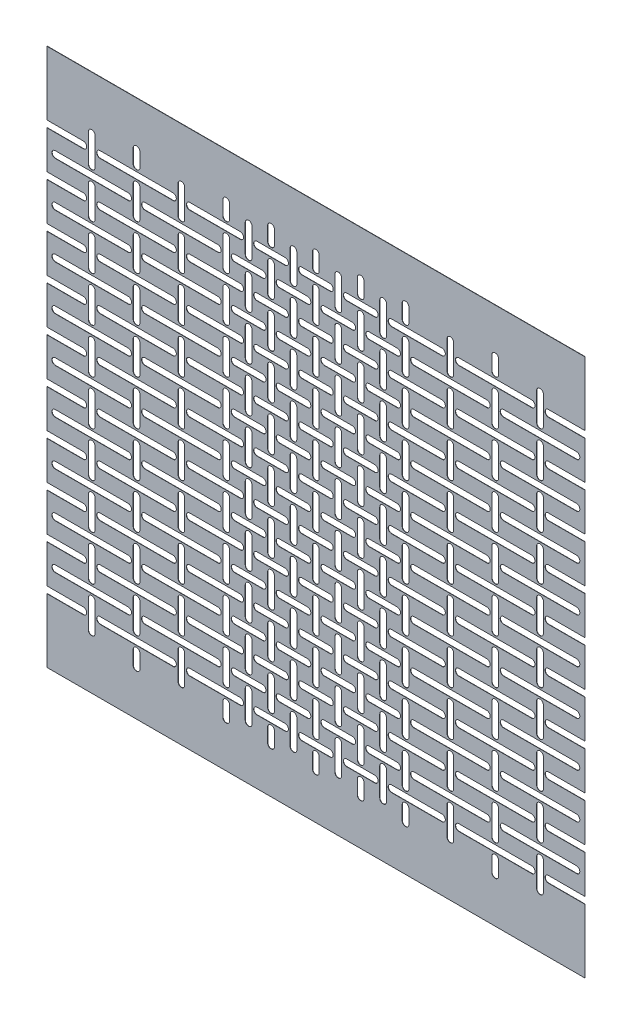
from build123d import *

# Parameters (mm, degrees)
BOSS_EXTRUDE1_DEPTH = 0.127


with BuildPart() as part:
    # Model → Boss-Extrude1 (new body)
    with BuildSketch(Plane.XY):
        with BuildLine():
            Line((0, 31.5), (16.25, 31.5))
            ThreePointArc((16.25, 31.5), (17.75, 30), (16.25, 28.5))
            Line((16.25, 28.5), (0, 28.5))
            Line((0, 28.5), (0, 0))
            Line((0, 0), (80, 0))
            Line((80, 0), (160, 0))
            Line((160, 0), (240, 0))
            Line((240, 0), (240, 28.5))
            Line((240, 28.5), (223.75, 28.5))
            ThreePointArc((223.75, 28.5), (222.25, 30), (223.75, 31.5))
            Line((223.75, 31.5), (240, 31.5))
            Line((240, 31.5), (240, 48.5))
            Line((240, 48.5), (223.75, 48.5))
            ThreePointArc((223.75, 48.5), (222.25, 50), (223.75, 51.5))
            Line((223.75, 51.5), (240, 51.5))
            Line((240, 51.5), (240, 68.5))
            Line((240, 68.5), (223.75, 68.5))
            ThreePointArc((223.75, 68.5), (222.25, 70), (223.75, 71.5))
            Line((223.75, 71.5), (240, 71.5))
            Line((240, 71.5), (240, 88.5))
            Line((240, 88.5), (223.75, 88.5))
            ThreePointArc((223.75, 88.5), (222.25, 90), (223.75, 91.5))
            Line((223.75, 91.5), (240, 91.5))
            Line((240, 91.5), (240, 108.5))
            Line((240, 108.5), (223.75, 108.5))
            ThreePointArc((223.75, 108.5), (222.25, 110), (223.75, 111.5))
            Line((223.75, 111.5), (240, 111.5))
            Line((240, 111.5), (240, 128.5))
            Line((240, 128.5), (223.75, 128.5))
            ThreePointArc((223.75, 128.5), (222.25, 130), (223.75, 131.5))
            Line((223.75, 131.5), (240, 131.5))
            Line((240, 131.5), (240, 148.5))
            Line((240, 148.5), (223.75, 148.5))
            ThreePointArc((223.75, 148.5), (222.25, 150), (223.75, 151.5))
            Line((223.75, 151.5), (240, 151.5))
            Line((240, 151.5), (240, 168.5))
            Line((240, 168.5), (223.75, 168.5))
            ThreePointArc((223.75, 168.5), (222.25, 170), (223.75, 171.5))
            Line((223.75, 171.5), (240, 171.5))
            Line((240, 171.5), (240, 188.5))
            Line((240, 188.5), (223.75, 188.5))
            ThreePointArc((223.75, 188.5), (222.25, 190), (223.75, 191.5))
            Line((223.75, 191.5), (240, 191.5))
            Line((240, 191.5), (240, 208.5))
            Line((240, 208.5), (223.75, 208.5))
            ThreePointArc((223.75, 208.5), (222.25, 210), (223.75, 211.5))
            Line((223.75, 211.5), (240, 211.5))
            Line((240, 211.5), (240, 240))
            Line((240, 240), (160, 240))
            Line((160, 240), (80, 240))
            Line((80, 240), (0, 240))
            Line((0, 240), (0, 211.5))
            Line((0, 211.5), (16.25, 211.5))
            ThreePointArc((16.25, 211.5), (17.75, 210), (16.25, 208.5))
            Line((16.25, 208.5), (0, 208.5))
            Line((0, 208.5), (0, 191.5))
            Line((0, 191.5), (16.25, 191.5))
            ThreePointArc((16.25, 191.5), (17.75, 190), (16.25, 188.5))
            Line((16.25, 188.5), (0, 188.5))
            Line((0, 188.5), (0, 171.5))
            Line((0, 171.5), (16.25, 171.5))
            ThreePointArc((16.25, 171.5), (17.75, 170), (16.25, 168.5))
            Line((16.25, 168.5), (0, 168.5))
            Line((0, 168.5), (0, 151.5))
            Line((0, 151.5), (16.25, 151.5))
            ThreePointArc((16.25, 151.5), (17.75, 150), (16.25, 148.5))
            Line((16.25, 148.5), (0, 148.5))
            Line((0, 148.5), (0, 131.5))
            Line((0, 131.5), (16.25, 131.5))
            ThreePointArc((16.25, 131.5), (17.75, 130), (16.25, 128.5))
            Line((16.25, 128.5), (0, 128.5))
            Line((0, 128.5), (0, 111.5))
            Line((0, 111.5), (16.25, 111.5))
            ThreePointArc((16.25, 111.5), (17.75, 110), (16.25, 108.5))
            Line((16.25, 108.5), (0, 108.5))
            Line((0, 108.5), (0, 91.5))
            Line((0, 91.5), (16.25, 91.5))
            ThreePointArc((16.25, 91.5), (17.75, 90), (16.25, 88.5))
            Line((16.25, 88.5), (0, 88.5))
            Line((0, 88.5), (0, 71.5))
            Line((0, 71.5), (16.25, 71.5))
            ThreePointArc((16.25, 71.5), (17.75, 70), (16.25, 68.5))
            Line((16.25, 68.5), (0, 68.5))
            Line((0, 68.5), (0, 51.5))
            Line((0, 51.5), (16.25, 51.5))
            ThreePointArc((16.25, 51.5), (17.75, 50), (16.25, 48.5))
            Line((16.25, 48.5), (0, 48.5))
            Line((0, 48.5), (0, 31.5))
        make_face()
        with BuildLine():
            Line((23.75, 31.5), (56.25, 31.5))
            ThreePointArc((56.25, 31.5), (57.75, 30), (56.25, 28.5))
            Line((56.25, 28.5), (23.75, 28.5))
            ThreePointArc((23.75, 28.5), (22.25, 30), (23.75, 31.5))
        make_face(mode=Mode.SUBTRACT)
        with BuildLine():
            Line((63.75, 31.5), (80, 31.5))
            Line((80, 31.5), (86.25, 31.5))
            ThreePointArc((86.25, 31.5), (87.75, 30), (86.25, 28.5))
            Line((86.25, 28.5), (80, 28.5))
            Line((80, 28.5), (63.75, 28.5))
            ThreePointArc((63.75, 28.5), (62.25, 30), (63.75, 31.5))
        make_face(mode=Mode.SUBTRACT)
        with BuildLine():
            Line((3.75, 41.5), (36.25, 41.5))
            ThreePointArc((36.25, 41.5), (37.75, 40), (36.25, 38.5))
            Line((36.25, 38.5), (3.75, 38.5))
            ThreePointArc((3.75, 38.5), (2.25, 40), (3.75, 41.5))
        make_face(mode=Mode.SUBTRACT)
        with BuildLine():
            Line((43.75, 41.5), (76.25, 41.5))
            ThreePointArc((76.25, 41.5), (77.75, 40), (76.25, 38.5))
            Line((76.25, 38.5), (43.75, 38.5))
            ThreePointArc((43.75, 38.5), (42.25, 40), (43.75, 41.5))
        make_face(mode=Mode.SUBTRACT)
        with BuildLine():
            Line((23.75, 51.5), (56.25, 51.5))
            ThreePointArc((56.25, 51.5), (57.75, 50), (56.25, 48.5))
            Line((56.25, 48.5), (23.75, 48.5))
            ThreePointArc((23.75, 48.5), (22.25, 50), (23.75, 51.5))
        make_face(mode=Mode.SUBTRACT)
        with BuildLine():
            Line((63.75, 51.5), (80, 51.5))
            Line((80, 51.5), (86.25, 51.5))
            ThreePointArc((86.25, 51.5), (87.75, 50), (86.25, 48.5))
            Line((86.25, 48.5), (80, 48.5))
            Line((80, 48.5), (63.75, 48.5))
            ThreePointArc((63.75, 48.5), (62.25, 50), (63.75, 51.5))
        make_face(mode=Mode.SUBTRACT)
        with BuildLine():
            Line((3.75, 61.5), (36.25, 61.5))
            ThreePointArc((36.25, 61.5), (37.75, 60), (36.25, 58.5))
            Line((36.25, 58.5), (3.75, 58.5))
            ThreePointArc((3.75, 58.5), (2.25, 60), (3.75, 61.5))
        make_face(mode=Mode.SUBTRACT)
        with BuildLine():
            Line((43.75, 61.5), (76.25, 61.5))
            ThreePointArc((76.25, 61.5), (77.75, 60), (76.25, 58.5))
            Line((76.25, 58.5), (43.75, 58.5))
            ThreePointArc((43.75, 58.5), (42.25, 60), (43.75, 61.5))
        make_face(mode=Mode.SUBTRACT)
        with BuildLine():
            Line((23.75, 71.5), (56.25, 71.5))
            ThreePointArc((56.25, 71.5), (57.75, 70), (56.25, 68.5))
            Line((56.25, 68.5), (23.75, 68.5))
            ThreePointArc((23.75, 68.5), (22.25, 70), (23.75, 71.5))
        make_face(mode=Mode.SUBTRACT)
        with BuildLine():
            Line((63.75, 71.5), (80, 71.5))
            Line((80, 71.5), (86.25, 71.5))
            ThreePointArc((86.25, 71.5), (87.75, 70), (86.25, 68.5))
            Line((86.25, 68.5), (80, 68.5))
            Line((80, 68.5), (63.75, 68.5))
            ThreePointArc((63.75, 68.5), (62.25, 70), (63.75, 71.5))
        make_face(mode=Mode.SUBTRACT)
        with BuildLine():
            Line((3.75, 81.5), (36.25, 81.5))
            ThreePointArc((36.25, 81.5), (37.75, 80), (36.25, 78.5))
            Line((36.25, 78.5), (3.75, 78.5))
            ThreePointArc((3.75, 78.5), (2.25, 80), (3.75, 81.5))
        make_face(mode=Mode.SUBTRACT)
        with BuildLine():
            Line((43.75, 81.5), (76.25, 81.5))
            ThreePointArc((76.25, 81.5), (77.75, 80), (76.25, 78.5))
            Line((76.25, 78.5), (43.75, 78.5))
            ThreePointArc((43.75, 78.5), (42.25, 80), (43.75, 81.5))
        make_face(mode=Mode.SUBTRACT)
        with BuildLine():
            Line((23.75, 91.5), (56.25, 91.5))
            ThreePointArc((56.25, 91.5), (57.75, 90), (56.25, 88.5))
            Line((56.25, 88.5), (23.75, 88.5))
            ThreePointArc((23.75, 88.5), (22.25, 90), (23.75, 91.5))
        make_face(mode=Mode.SUBTRACT)
        with BuildLine():
            Line((63.75, 91.5), (80, 91.5))
            Line((80, 91.5), (86.25, 91.5))
            ThreePointArc((86.25, 91.5), (87.75, 90), (86.25, 88.5))
            Line((86.25, 88.5), (80, 88.5))
            Line((80, 88.5), (63.75, 88.5))
            ThreePointArc((63.75, 88.5), (62.25, 90), (63.75, 91.5))
        make_face(mode=Mode.SUBTRACT)
        with BuildLine():
            Line((3.75, 101.5), (36.25, 101.5))
            ThreePointArc((36.25, 101.5), (37.75, 100), (36.25, 98.5))
            Line((36.25, 98.5), (3.75, 98.5))
            ThreePointArc((3.75, 98.5), (2.25, 100), (3.75, 101.5))
        make_face(mode=Mode.SUBTRACT)
        with BuildLine():
            Line((43.75, 101.5), (76.25, 101.5))
            ThreePointArc((76.25, 101.5), (77.75, 100), (76.25, 98.5))
            Line((76.25, 98.5), (43.75, 98.5))
            ThreePointArc((43.75, 98.5), (42.25, 100), (43.75, 101.5))
        make_face(mode=Mode.SUBTRACT)
        with BuildLine():
            Line((23.75, 111.5), (56.25, 111.5))
            ThreePointArc((56.25, 111.5), (57.75, 110), (56.25, 108.5))
            Line((56.25, 108.5), (23.75, 108.5))
            ThreePointArc((23.75, 108.5), (22.25, 110), (23.75, 111.5))
        make_face(mode=Mode.SUBTRACT)
        with BuildLine():
            Line((63.75, 111.5), (80, 111.5))
            Line((80, 111.5), (86.25, 111.5))
            ThreePointArc((86.25, 111.5), (87.75, 110), (86.25, 108.5))
            Line((86.25, 108.5), (80, 108.5))
            Line((80, 108.5), (63.75, 108.5))
            ThreePointArc((63.75, 108.5), (62.25, 110), (63.75, 111.5))
        make_face(mode=Mode.SUBTRACT)
        with BuildLine():
            Line((3.75, 121.5), (36.25, 121.5))
            ThreePointArc((36.25, 121.5), (37.75, 120), (36.25, 118.5))
            Line((36.25, 118.5), (3.75, 118.5))
            ThreePointArc((3.75, 118.5), (2.25, 120), (3.75, 121.5))
        make_face(mode=Mode.SUBTRACT)
        with BuildLine():
            Line((43.75, 121.5), (76.25, 121.5))
            ThreePointArc((76.25, 121.5), (77.75, 120), (76.25, 118.5))
            Line((76.25, 118.5), (43.75, 118.5))
            ThreePointArc((43.75, 118.5), (42.25, 120), (43.75, 121.5))
        make_face(mode=Mode.SUBTRACT)
        with BuildLine():
            Line((23.75, 131.5), (56.25, 131.5))
            ThreePointArc((56.25, 131.5), (57.75, 130), (56.25, 128.5))
            Line((56.25, 128.5), (23.75, 128.5))
            ThreePointArc((23.75, 128.5), (22.25, 130), (23.75, 131.5))
        make_face(mode=Mode.SUBTRACT)
        with BuildLine():
            Line((63.75, 131.5), (80, 131.5))
            Line((80, 131.5), (86.25, 131.5))
            ThreePointArc((86.25, 131.5), (87.75, 130), (86.25, 128.5))
            Line((86.25, 128.5), (80, 128.5))
            Line((80, 128.5), (63.75, 128.5))
            ThreePointArc((63.75, 128.5), (62.25, 130), (63.75, 131.5))
        make_face(mode=Mode.SUBTRACT)
        with BuildLine():
            Line((3.75, 141.5), (36.25, 141.5))
            ThreePointArc((36.25, 141.5), (37.75, 140), (36.25, 138.5))
            Line((36.25, 138.5), (3.75, 138.5))
            ThreePointArc((3.75, 138.5), (2.25, 140), (3.75, 141.5))
        make_face(mode=Mode.SUBTRACT)
        with BuildLine():
            Line((43.75, 141.5), (76.25, 141.5))
            ThreePointArc((76.25, 141.5), (77.75, 140), (76.25, 138.5))
            Line((76.25, 138.5), (43.75, 138.5))
            ThreePointArc((43.75, 138.5), (42.25, 140), (43.75, 141.5))
        make_face(mode=Mode.SUBTRACT)
        with BuildLine():
            Line((23.75, 151.5), (56.25, 151.5))
            ThreePointArc((56.25, 151.5), (57.75, 150), (56.25, 148.5))
            Line((56.25, 148.5), (23.75, 148.5))
            ThreePointArc((23.75, 148.5), (22.25, 150), (23.75, 151.5))
        make_face(mode=Mode.SUBTRACT)
        with BuildLine():
            Line((63.75, 151.5), (80, 151.5))
            Line((80, 151.5), (86.25, 151.5))
            ThreePointArc((86.25, 151.5), (87.75, 150), (86.25, 148.5))
            Line((86.25, 148.5), (80, 148.5))
            Line((80, 148.5), (63.75, 148.5))
            ThreePointArc((63.75, 148.5), (62.25, 150), (63.75, 151.5))
        make_face(mode=Mode.SUBTRACT)
        with BuildLine():
            Line((3.75, 161.5), (36.25, 161.5))
            ThreePointArc((36.25, 161.5), (37.75, 160), (36.25, 158.5))
            Line((36.25, 158.5), (3.75, 158.5))
            ThreePointArc((3.75, 158.5), (2.25, 160), (3.75, 161.5))
        make_face(mode=Mode.SUBTRACT)
        with BuildLine():
            Line((43.75, 161.5), (76.25, 161.5))
            ThreePointArc((76.25, 161.5), (77.75, 160), (76.25, 158.5))
            Line((76.25, 158.5), (43.75, 158.5))
            ThreePointArc((43.75, 158.5), (42.25, 160), (43.75, 161.5))
        make_face(mode=Mode.SUBTRACT)
        with BuildLine():
            Line((23.75, 171.5), (56.25, 171.5))
            ThreePointArc((56.25, 171.5), (57.75, 170), (56.25, 168.5))
            Line((56.25, 168.5), (23.75, 168.5))
            ThreePointArc((23.75, 168.5), (22.25, 170), (23.75, 171.5))
        make_face(mode=Mode.SUBTRACT)
        with BuildLine():
            Line((63.75, 171.5), (80, 171.5))
            Line((80, 171.5), (86.25, 171.5))
            ThreePointArc((86.25, 171.5), (87.75, 170), (86.25, 168.5))
            Line((86.25, 168.5), (80, 168.5))
            Line((80, 168.5), (63.75, 168.5))
            ThreePointArc((63.75, 168.5), (62.25, 170), (63.75, 171.5))
        make_face(mode=Mode.SUBTRACT)
        with BuildLine():
            Line((3.75, 181.5), (36.25, 181.5))
            ThreePointArc((36.25, 181.5), (37.75, 180), (36.25, 178.5))
            Line((36.25, 178.5), (3.75, 178.5))
            ThreePointArc((3.75, 178.5), (2.25, 180), (3.75, 181.5))
        make_face(mode=Mode.SUBTRACT)
        with BuildLine():
            Line((43.75, 181.5), (76.25, 181.5))
            ThreePointArc((76.25, 181.5), (77.75, 180), (76.25, 178.5))
            Line((76.25, 178.5), (43.75, 178.5))
            ThreePointArc((43.75, 178.5), (42.25, 180), (43.75, 181.5))
        make_face(mode=Mode.SUBTRACT)
        with BuildLine():
            Line((23.75, 191.5), (56.25, 191.5))
            ThreePointArc((56.25, 191.5), (57.75, 190), (56.25, 188.5))
            Line((56.25, 188.5), (23.75, 188.5))
            ThreePointArc((23.75, 188.5), (22.25, 190), (23.75, 191.5))
        make_face(mode=Mode.SUBTRACT)
        with BuildLine():
            Line((63.75, 191.5), (80, 191.5))
            Line((80, 191.5), (86.25, 191.5))
            ThreePointArc((86.25, 191.5), (87.75, 190), (86.25, 188.5))
            Line((86.25, 188.5), (80, 188.5))
            Line((80, 188.5), (63.75, 188.5))
            ThreePointArc((63.75, 188.5), (62.25, 190), (63.75, 191.5))
        make_face(mode=Mode.SUBTRACT)
        with BuildLine():
            Line((3.75, 201.5), (36.25, 201.5))
            ThreePointArc((36.25, 201.5), (37.75, 200), (36.25, 198.5))
            Line((36.25, 198.5), (3.75, 198.5))
            ThreePointArc((3.75, 198.5), (2.25, 200), (3.75, 201.5))
        make_face(mode=Mode.SUBTRACT)
        with BuildLine():
            Line((43.75, 201.5), (76.25, 201.5))
            ThreePointArc((76.25, 201.5), (77.75, 200), (76.25, 198.5))
            Line((76.25, 198.5), (43.75, 198.5))
            ThreePointArc((43.75, 198.5), (42.25, 200), (43.75, 201.5))
        make_face(mode=Mode.SUBTRACT)
        with BuildLine():
            Line((23.75, 211.5), (56.25, 211.5))
            ThreePointArc((56.25, 211.5), (57.75, 210), (56.25, 208.5))
            Line((56.25, 208.5), (23.75, 208.5))
            ThreePointArc((23.75, 208.5), (22.25, 210), (23.75, 211.5))
        make_face(mode=Mode.SUBTRACT)
        with BuildLine():
            Line((63.75, 211.5), (80, 211.5))
            Line((80, 211.5), (86.25, 211.5))
            ThreePointArc((86.25, 211.5), (87.75, 210), (86.25, 208.5))
            Line((86.25, 208.5), (80, 208.5))
            Line((80, 208.5), (63.75, 208.5))
            ThreePointArc((63.75, 208.5), (62.25, 210), (63.75, 211.5))
        make_face(mode=Mode.SUBTRACT)
        with BuildLine():
            Line((21.5, 23.75), (21.5, 36.25))
            ThreePointArc((21.5, 36.25), (20, 37.75), (18.5, 36.25))
            Line((18.5, 36.25), (18.5, 23.75))
            ThreePointArc((18.5, 23.75), (20, 22.25), (21.5, 23.75))
        make_face(mode=Mode.SUBTRACT)
        with BuildLine():
            Line((21.5, 43.75), (21.5, 56.25))
            ThreePointArc((21.5, 56.25), (20, 57.75), (18.5, 56.25))
            Line((18.5, 56.25), (18.5, 43.75))
            ThreePointArc((18.5, 43.75), (20, 42.25), (21.5, 43.75))
        make_face(mode=Mode.SUBTRACT)
        with BuildLine():
            Line((21.5, 63.75), (21.5, 76.25))
            ThreePointArc((21.5, 76.25), (20, 77.75), (18.5, 76.25))
            Line((18.5, 76.25), (18.5, 63.75))
            ThreePointArc((18.5, 63.75), (20, 62.25), (21.5, 63.75))
        make_face(mode=Mode.SUBTRACT)
        with BuildLine():
            Line((21.5, 83.75), (21.5, 96.25))
            ThreePointArc((21.5, 96.25), (20, 97.75), (18.5, 96.25))
            Line((18.5, 96.25), (18.5, 83.75))
            ThreePointArc((18.5, 83.75), (20, 82.25), (21.5, 83.75))
        make_face(mode=Mode.SUBTRACT)
        with BuildLine():
            Line((21.5, 103.75), (21.5, 116.25))
            ThreePointArc((21.5, 116.25), (20, 117.75), (18.5, 116.25))
            Line((18.5, 116.25), (18.5, 103.75))
            ThreePointArc((18.5, 103.75), (20, 102.25), (21.5, 103.75))
        make_face(mode=Mode.SUBTRACT)
        with BuildLine():
            Line((21.5, 123.75), (21.5, 136.25))
            ThreePointArc((21.5, 136.25), (20, 137.75), (18.5, 136.25))
            Line((18.5, 136.25), (18.5, 123.75))
            ThreePointArc((18.5, 123.75), (20, 122.25), (21.5, 123.75))
        make_face(mode=Mode.SUBTRACT)
        with BuildLine():
            Line((21.5, 143.75), (21.5, 156.25))
            ThreePointArc((21.5, 156.25), (20, 157.75), (18.5, 156.25))
            Line((18.5, 156.25), (18.5, 143.75))
            ThreePointArc((18.5, 143.75), (20, 142.25), (21.5, 143.75))
        make_face(mode=Mode.SUBTRACT)
        with BuildLine():
            Line((21.5, 163.75), (21.5, 176.25))
            ThreePointArc((21.5, 176.25), (20, 177.75), (18.5, 176.25))
            Line((18.5, 176.25), (18.5, 163.75))
            ThreePointArc((18.5, 163.75), (20, 162.25), (21.5, 163.75))
        make_face(mode=Mode.SUBTRACT)
        with BuildLine():
            Line((21.5, 183.75), (21.5, 196.25))
            ThreePointArc((21.5, 196.25), (20, 197.75), (18.5, 196.25))
            Line((18.5, 196.25), (18.5, 183.75))
            ThreePointArc((18.5, 183.75), (20, 182.25), (21.5, 183.75))
        make_face(mode=Mode.SUBTRACT)
        with BuildLine():
            Line((21.5, 203.75), (21.5, 216.25))
            ThreePointArc((21.5, 216.25), (20, 217.75), (18.5, 216.25))
            Line((18.5, 216.25), (18.5, 203.75))
            ThreePointArc((18.5, 203.75), (20, 202.25), (21.5, 203.75))
        make_face(mode=Mode.SUBTRACT)
        with BuildLine():
            Line((41.5, 20), (41.5, 26.25))
            ThreePointArc((41.5, 26.25), (40, 27.75), (38.5, 26.25))
            Line((38.5, 26.25), (38.5, 20))
            ThreePointArc((38.5, 20), (40, 18.5), (41.5, 20))
        make_face(mode=Mode.SUBTRACT)
        with BuildLine():
            Line((41.5, 33.75), (41.5, 46.25))
            ThreePointArc((41.5, 46.25), (40, 47.75), (38.5, 46.25))
            Line((38.5, 46.25), (38.5, 33.75))
            ThreePointArc((38.5, 33.75), (40, 32.25), (41.5, 33.75))
        make_face(mode=Mode.SUBTRACT)
        with BuildLine():
            Line((41.5, 53.75), (41.5, 66.25))
            ThreePointArc((41.5, 66.25), (40, 67.75), (38.5, 66.25))
            Line((38.5, 66.25), (38.5, 53.75))
            ThreePointArc((38.5, 53.75), (40, 52.25), (41.5, 53.75))
        make_face(mode=Mode.SUBTRACT)
        with BuildLine():
            Line((41.5, 73.75), (41.5, 86.25))
            ThreePointArc((41.5, 86.25), (40, 87.75), (38.5, 86.25))
            Line((38.5, 86.25), (38.5, 73.75))
            ThreePointArc((38.5, 73.75), (40, 72.25), (41.5, 73.75))
        make_face(mode=Mode.SUBTRACT)
        with BuildLine():
            Line((41.5, 93.75), (41.5, 106.25))
            ThreePointArc((41.5, 106.25), (40, 107.75), (38.5, 106.25))
            Line((38.5, 106.25), (38.5, 93.75))
            ThreePointArc((38.5, 93.75), (40, 92.25), (41.5, 93.75))
        make_face(mode=Mode.SUBTRACT)
        with BuildLine():
            Line((41.5, 113.75), (41.5, 126.25))
            ThreePointArc((41.5, 126.25), (40, 127.75), (38.5, 126.25))
            Line((38.5, 126.25), (38.5, 113.75))
            ThreePointArc((38.5, 113.75), (40, 112.25), (41.5, 113.75))
        make_face(mode=Mode.SUBTRACT)
        with BuildLine():
            Line((41.5, 133.75), (41.5, 146.25))
            ThreePointArc((41.5, 146.25), (40, 147.75), (38.5, 146.25))
            Line((38.5, 146.25), (38.5, 133.75))
            ThreePointArc((38.5, 133.75), (40, 132.25), (41.5, 133.75))
        make_face(mode=Mode.SUBTRACT)
        with BuildLine():
            Line((41.5, 153.75), (41.5, 166.25))
            ThreePointArc((41.5, 166.25), (40, 167.75), (38.5, 166.25))
            Line((38.5, 166.25), (38.5, 153.75))
            ThreePointArc((38.5, 153.75), (40, 152.25), (41.5, 153.75))
        make_face(mode=Mode.SUBTRACT)
        with BuildLine():
            Line((41.5, 173.75), (41.5, 186.25))
            ThreePointArc((41.5, 186.25), (40, 187.75), (38.5, 186.25))
            Line((38.5, 186.25), (38.5, 173.75))
            ThreePointArc((38.5, 173.75), (40, 172.25), (41.5, 173.75))
        make_face(mode=Mode.SUBTRACT)
        with BuildLine():
            Line((41.5, 193.75), (41.5, 206.25))
            ThreePointArc((41.5, 206.25), (40, 207.75), (38.5, 206.25))
            Line((38.5, 206.25), (38.5, 193.75))
            ThreePointArc((38.5, 193.75), (40, 192.25), (41.5, 193.75))
        make_face(mode=Mode.SUBTRACT)
        with BuildLine():
            Line((41.5, 213.75), (41.5, 220))
            ThreePointArc((41.5, 220), (40, 221.5), (38.5, 220))
            Line((38.5, 220), (38.5, 213.75))
            ThreePointArc((38.5, 213.75), (40, 212.25), (41.5, 213.75))
        make_face(mode=Mode.SUBTRACT)
        with BuildLine():
            Line((61.5, 23.75), (61.5, 36.25))
            ThreePointArc((61.5, 36.25), (60, 37.75), (58.5, 36.25))
            Line((58.5, 36.25), (58.5, 23.75))
            ThreePointArc((58.5, 23.75), (60, 22.25), (61.5, 23.75))
        make_face(mode=Mode.SUBTRACT)
        with BuildLine():
            Line((61.5, 43.75), (61.5, 56.25))
            ThreePointArc((61.5, 56.25), (60, 57.75), (58.5, 56.25))
            Line((58.5, 56.25), (58.5, 43.75))
            ThreePointArc((58.5, 43.75), (60, 42.25), (61.5, 43.75))
        make_face(mode=Mode.SUBTRACT)
        with BuildLine():
            Line((61.5, 63.75), (61.5, 76.25))
            ThreePointArc((61.5, 76.25), (60, 77.75), (58.5, 76.25))
            Line((58.5, 76.25), (58.5, 63.75))
            ThreePointArc((58.5, 63.75), (60, 62.25), (61.5, 63.75))
        make_face(mode=Mode.SUBTRACT)
        with BuildLine():
            Line((61.5, 83.75), (61.5, 96.25))
            ThreePointArc((61.5, 96.25), (60, 97.75), (58.5, 96.25))
            Line((58.5, 96.25), (58.5, 83.75))
            ThreePointArc((58.5, 83.75), (60, 82.25), (61.5, 83.75))
        make_face(mode=Mode.SUBTRACT)
        with BuildLine():
            Line((61.5, 103.75), (61.5, 116.25))
            ThreePointArc((61.5, 116.25), (60, 117.75), (58.5, 116.25))
            Line((58.5, 116.25), (58.5, 103.75))
            ThreePointArc((58.5, 103.75), (60, 102.25), (61.5, 103.75))
        make_face(mode=Mode.SUBTRACT)
        with BuildLine():
            Line((61.5, 123.75), (61.5, 136.25))
            ThreePointArc((61.5, 136.25), (60, 137.75), (58.5, 136.25))
            Line((58.5, 136.25), (58.5, 123.75))
            ThreePointArc((58.5, 123.75), (60, 122.25), (61.5, 123.75))
        make_face(mode=Mode.SUBTRACT)
        with BuildLine():
            Line((61.5, 143.75), (61.5, 156.25))
            ThreePointArc((61.5, 156.25), (60, 157.75), (58.5, 156.25))
            Line((58.5, 156.25), (58.5, 143.75))
            ThreePointArc((58.5, 143.75), (60, 142.25), (61.5, 143.75))
        make_face(mode=Mode.SUBTRACT)
        with BuildLine():
            Line((61.5, 163.75), (61.5, 176.25))
            ThreePointArc((61.5, 176.25), (60, 177.75), (58.5, 176.25))
            Line((58.5, 176.25), (58.5, 163.75))
            ThreePointArc((58.5, 163.75), (60, 162.25), (61.5, 163.75))
        make_face(mode=Mode.SUBTRACT)
        with BuildLine():
            Line((61.5, 183.75), (61.5, 196.25))
            ThreePointArc((61.5, 196.25), (60, 197.75), (58.5, 196.25))
            Line((58.5, 196.25), (58.5, 183.75))
            ThreePointArc((58.5, 183.75), (60, 182.25), (61.5, 183.75))
        make_face(mode=Mode.SUBTRACT)
        with BuildLine():
            Line((61.5, 203.75), (61.5, 216.25))
            ThreePointArc((61.5, 216.25), (60, 217.75), (58.5, 216.25))
            Line((58.5, 216.25), (58.5, 203.75))
            ThreePointArc((58.5, 203.75), (60, 202.25), (61.5, 203.75))
        make_face(mode=Mode.SUBTRACT)
        with BuildLine():
            Line((81.5, 20), (81.5, 26.25))
            ThreePointArc((81.5, 26.25), (80, 27.75), (78.5, 26.25))
            Line((78.5, 26.25), (78.5, 20))
            ThreePointArc((78.5, 20), (80, 18.5), (81.5, 20))
        make_face(mode=Mode.SUBTRACT)
        with BuildLine():
            Line((81.5, 33.75), (81.5, 46.25))
            ThreePointArc((81.5, 46.25), (80, 47.75), (78.5, 46.25))
            Line((78.5, 46.25), (78.5, 33.75))
            ThreePointArc((78.5, 33.75), (80, 32.25), (81.5, 33.75))
        make_face(mode=Mode.SUBTRACT)
        with BuildLine():
            Line((81.5, 53.75), (81.5, 66.25))
            ThreePointArc((81.5, 66.25), (80, 67.75), (78.5, 66.25))
            Line((78.5, 66.25), (78.5, 53.75))
            ThreePointArc((78.5, 53.75), (80, 52.25), (81.5, 53.75))
        make_face(mode=Mode.SUBTRACT)
        with BuildLine():
            Line((81.5, 73.75), (81.5, 86.25))
            ThreePointArc((81.5, 86.25), (80, 87.75), (78.5, 86.25))
            Line((78.5, 86.25), (78.5, 73.75))
            ThreePointArc((78.5, 73.75), (80, 72.25), (81.5, 73.75))
        make_face(mode=Mode.SUBTRACT)
        with BuildLine():
            Line((81.5, 93.75), (81.5, 106.25))
            ThreePointArc((81.5, 106.25), (80, 107.75), (78.5, 106.25))
            Line((78.5, 106.25), (78.5, 93.75))
            ThreePointArc((78.5, 93.75), (80, 92.25), (81.5, 93.75))
        make_face(mode=Mode.SUBTRACT)
        with BuildLine():
            Line((81.5, 113.75), (81.5, 126.25))
            ThreePointArc((81.5, 126.25), (80, 127.75), (78.5, 126.25))
            Line((78.5, 126.25), (78.5, 113.75))
            ThreePointArc((78.5, 113.75), (80, 112.25), (81.5, 113.75))
        make_face(mode=Mode.SUBTRACT)
        with BuildLine():
            Line((81.5, 133.75), (81.5, 146.25))
            ThreePointArc((81.5, 146.25), (80, 147.75), (78.5, 146.25))
            Line((78.5, 146.25), (78.5, 133.75))
            ThreePointArc((78.5, 133.75), (80, 132.25), (81.5, 133.75))
        make_face(mode=Mode.SUBTRACT)
        with BuildLine():
            Line((81.5, 153.75), (81.5, 166.25))
            ThreePointArc((81.5, 166.25), (80, 167.75), (78.5, 166.25))
            Line((78.5, 166.25), (78.5, 153.75))
            ThreePointArc((78.5, 153.75), (80, 152.25), (81.5, 153.75))
        make_face(mode=Mode.SUBTRACT)
        with BuildLine():
            Line((81.5, 173.75), (81.5, 186.25))
            ThreePointArc((81.5, 186.25), (80, 187.75), (78.5, 186.25))
            Line((78.5, 186.25), (78.5, 173.75))
            ThreePointArc((78.5, 173.75), (80, 172.25), (81.5, 173.75))
        make_face(mode=Mode.SUBTRACT)
        with BuildLine():
            Line((81.5, 193.75), (81.5, 206.25))
            ThreePointArc((81.5, 206.25), (80, 207.75), (78.5, 206.25))
            Line((78.5, 206.25), (78.5, 193.75))
            ThreePointArc((78.5, 193.75), (80, 192.25), (81.5, 193.75))
        make_face(mode=Mode.SUBTRACT)
        with BuildLine():
            Line((81.5, 213.75), (81.5, 220))
            ThreePointArc((81.5, 220), (80, 221.5), (78.5, 220))
            Line((78.5, 220), (78.5, 213.75))
            ThreePointArc((78.5, 213.75), (80, 212.25), (81.5, 213.75))
        make_face(mode=Mode.SUBTRACT)
        with BuildLine():
            Line((93.75, 31.5), (106.25, 31.5))
            ThreePointArc((106.25, 31.5), (107.75, 30), (106.25, 28.5))
            Line((106.25, 28.5), (93.75, 28.5))
            ThreePointArc((93.75, 28.5), (92.25, 30), (93.75, 31.5))
        make_face(mode=Mode.SUBTRACT)
        with BuildLine():
            Line((113.75, 31.5), (126.25, 31.5))
            ThreePointArc((126.25, 31.5), (127.75, 30), (126.25, 28.5))
            Line((126.25, 28.5), (113.75, 28.5))
            ThreePointArc((113.75, 28.5), (112.25, 30), (113.75, 31.5))
        make_face(mode=Mode.SUBTRACT)
        with BuildLine():
            Line((133.75, 31.5), (146.25, 31.5))
            ThreePointArc((146.25, 31.5), (147.75, 30), (146.25, 28.5))
            Line((146.25, 28.5), (133.75, 28.5))
            ThreePointArc((133.75, 28.5), (132.25, 30), (133.75, 31.5))
        make_face(mode=Mode.SUBTRACT)
        with BuildLine():
            Line((153.75, 31.5), (160, 31.5))
            Line((160, 31.5), (176.25, 31.5))
            ThreePointArc((176.25, 31.5), (177.75, 30), (176.25, 28.5))
            Line((176.25, 28.5), (160, 28.5))
            Line((160, 28.5), (153.75, 28.5))
            ThreePointArc((153.75, 28.5), (152.25, 30), (153.75, 31.5))
        make_face(mode=Mode.SUBTRACT)
        with BuildLine():
            Line((83.75, 41.5), (96.25, 41.5))
            ThreePointArc((96.25, 41.5), (97.75, 40), (96.25, 38.5))
            Line((96.25, 38.5), (83.75, 38.5))
            ThreePointArc((83.75, 38.5), (82.25, 40), (83.75, 41.5))
        make_face(mode=Mode.SUBTRACT)
        with BuildLine():
            Line((103.75, 41.5), (116.25, 41.5))
            ThreePointArc((116.25, 41.5), (117.75, 40), (116.25, 38.5))
            Line((116.25, 38.5), (103.75, 38.5))
            ThreePointArc((103.75, 38.5), (102.25, 40), (103.75, 41.5))
        make_face(mode=Mode.SUBTRACT)
        with BuildLine():
            Line((123.75, 41.5), (136.25, 41.5))
            ThreePointArc((136.25, 41.5), (137.75, 40), (136.25, 38.5))
            Line((136.25, 38.5), (123.75, 38.5))
            ThreePointArc((123.75, 38.5), (122.25, 40), (123.75, 41.5))
        make_face(mode=Mode.SUBTRACT)
        with BuildLine():
            Line((143.75, 41.5), (156.25, 41.5))
            ThreePointArc((156.25, 41.5), (157.75, 40), (156.25, 38.5))
            Line((156.25, 38.5), (143.75, 38.5))
            ThreePointArc((143.75, 38.5), (142.25, 40), (143.75, 41.5))
        make_face(mode=Mode.SUBTRACT)
        with BuildLine():
            Line((93.75, 51.5), (106.25, 51.5))
            ThreePointArc((106.25, 51.5), (107.75, 50), (106.25, 48.5))
            Line((106.25, 48.5), (93.75, 48.5))
            ThreePointArc((93.75, 48.5), (92.25, 50), (93.75, 51.5))
        make_face(mode=Mode.SUBTRACT)
        with BuildLine():
            Line((113.75, 51.5), (126.25, 51.5))
            ThreePointArc((126.25, 51.5), (127.75, 50), (126.25, 48.5))
            Line((126.25, 48.5), (113.75, 48.5))
            ThreePointArc((113.75, 48.5), (112.25, 50), (113.75, 51.5))
        make_face(mode=Mode.SUBTRACT)
        with BuildLine():
            Line((133.75, 51.5), (146.25, 51.5))
            ThreePointArc((146.25, 51.5), (147.75, 50), (146.25, 48.5))
            Line((146.25, 48.5), (133.75, 48.5))
            ThreePointArc((133.75, 48.5), (132.25, 50), (133.75, 51.5))
        make_face(mode=Mode.SUBTRACT)
        with BuildLine():
            Line((153.75, 51.5), (160, 51.5))
            Line((160, 51.5), (176.25, 51.5))
            ThreePointArc((176.25, 51.5), (177.75, 50), (176.25, 48.5))
            Line((176.25, 48.5), (160, 48.5))
            Line((160, 48.5), (153.75, 48.5))
            ThreePointArc((153.75, 48.5), (152.25, 50), (153.75, 51.5))
        make_face(mode=Mode.SUBTRACT)
        with BuildLine():
            Line((83.75, 61.5), (96.25, 61.5))
            ThreePointArc((96.25, 61.5), (97.75, 60), (96.25, 58.5))
            Line((96.25, 58.5), (83.75, 58.5))
            ThreePointArc((83.75, 58.5), (82.25, 60), (83.75, 61.5))
        make_face(mode=Mode.SUBTRACT)
        with BuildLine():
            Line((103.75, 61.5), (116.25, 61.5))
            ThreePointArc((116.25, 61.5), (117.75, 60), (116.25, 58.5))
            Line((116.25, 58.5), (103.75, 58.5))
            ThreePointArc((103.75, 58.5), (102.25, 60), (103.75, 61.5))
        make_face(mode=Mode.SUBTRACT)
        with BuildLine():
            Line((123.75, 61.5), (136.25, 61.5))
            ThreePointArc((136.25, 61.5), (137.75, 60), (136.25, 58.5))
            Line((136.25, 58.5), (123.75, 58.5))
            ThreePointArc((123.75, 58.5), (122.25, 60), (123.75, 61.5))
        make_face(mode=Mode.SUBTRACT)
        with BuildLine():
            Line((143.75, 61.5), (156.25, 61.5))
            ThreePointArc((156.25, 61.5), (157.75, 60), (156.25, 58.5))
            Line((156.25, 58.5), (143.75, 58.5))
            ThreePointArc((143.75, 58.5), (142.25, 60), (143.75, 61.5))
        make_face(mode=Mode.SUBTRACT)
        with BuildLine():
            Line((93.75, 71.5), (106.25, 71.5))
            ThreePointArc((106.25, 71.5), (107.75, 70), (106.25, 68.5))
            Line((106.25, 68.5), (93.75, 68.5))
            ThreePointArc((93.75, 68.5), (92.25, 70), (93.75, 71.5))
        make_face(mode=Mode.SUBTRACT)
        with BuildLine():
            Line((113.75, 71.5), (126.25, 71.5))
            ThreePointArc((126.25, 71.5), (127.75, 70), (126.25, 68.5))
            Line((126.25, 68.5), (113.75, 68.5))
            ThreePointArc((113.75, 68.5), (112.25, 70), (113.75, 71.5))
        make_face(mode=Mode.SUBTRACT)
        with BuildLine():
            Line((133.75, 71.5), (146.25, 71.5))
            ThreePointArc((146.25, 71.5), (147.75, 70), (146.25, 68.5))
            Line((146.25, 68.5), (133.75, 68.5))
            ThreePointArc((133.75, 68.5), (132.25, 70), (133.75, 71.5))
        make_face(mode=Mode.SUBTRACT)
        with BuildLine():
            Line((153.75, 71.5), (160, 71.5))
            Line((160, 71.5), (176.25, 71.5))
            ThreePointArc((176.25, 71.5), (177.75, 70), (176.25, 68.5))
            Line((176.25, 68.5), (160, 68.5))
            Line((160, 68.5), (153.75, 68.5))
            ThreePointArc((153.75, 68.5), (152.25, 70), (153.75, 71.5))
        make_face(mode=Mode.SUBTRACT)
        with BuildLine():
            Line((83.75, 81.5), (96.25, 81.5))
            ThreePointArc((96.25, 81.5), (97.75, 80), (96.25, 78.5))
            Line((96.25, 78.5), (83.75, 78.5))
            ThreePointArc((83.75, 78.5), (82.25, 80), (83.75, 81.5))
        make_face(mode=Mode.SUBTRACT)
        with BuildLine():
            Line((103.75, 81.5), (116.25, 81.5))
            ThreePointArc((116.25, 81.5), (117.75, 80), (116.25, 78.5))
            Line((116.25, 78.5), (103.75, 78.5))
            ThreePointArc((103.75, 78.5), (102.25, 80), (103.75, 81.5))
        make_face(mode=Mode.SUBTRACT)
        with BuildLine():
            Line((123.75, 81.5), (136.25, 81.5))
            ThreePointArc((136.25, 81.5), (137.75, 80), (136.25, 78.5))
            Line((136.25, 78.5), (123.75, 78.5))
            ThreePointArc((123.75, 78.5), (122.25, 80), (123.75, 81.5))
        make_face(mode=Mode.SUBTRACT)
        with BuildLine():
            Line((143.75, 81.5), (156.25, 81.5))
            ThreePointArc((156.25, 81.5), (157.75, 80), (156.25, 78.5))
            Line((156.25, 78.5), (143.75, 78.5))
            ThreePointArc((143.75, 78.5), (142.25, 80), (143.75, 81.5))
        make_face(mode=Mode.SUBTRACT)
        with BuildLine():
            Line((93.75, 91.5), (106.25, 91.5))
            ThreePointArc((106.25, 91.5), (107.75, 90), (106.25, 88.5))
            Line((106.25, 88.5), (93.75, 88.5))
            ThreePointArc((93.75, 88.5), (92.25, 90), (93.75, 91.5))
        make_face(mode=Mode.SUBTRACT)
        with BuildLine():
            Line((113.75, 91.5), (126.25, 91.5))
            ThreePointArc((126.25, 91.5), (127.75, 90), (126.25, 88.5))
            Line((126.25, 88.5), (113.75, 88.5))
            ThreePointArc((113.75, 88.5), (112.25, 90), (113.75, 91.5))
        make_face(mode=Mode.SUBTRACT)
        with BuildLine():
            Line((133.75, 91.5), (146.25, 91.5))
            ThreePointArc((146.25, 91.5), (147.75, 90), (146.25, 88.5))
            Line((146.25, 88.5), (133.75, 88.5))
            ThreePointArc((133.75, 88.5), (132.25, 90), (133.75, 91.5))
        make_face(mode=Mode.SUBTRACT)
        with BuildLine():
            Line((153.75, 91.5), (160, 91.5))
            Line((160, 91.5), (176.25, 91.5))
            ThreePointArc((176.25, 91.5), (177.75, 90), (176.25, 88.5))
            Line((176.25, 88.5), (160, 88.5))
            Line((160, 88.5), (153.75, 88.5))
            ThreePointArc((153.75, 88.5), (152.25, 90), (153.75, 91.5))
        make_face(mode=Mode.SUBTRACT)
        with BuildLine():
            Line((83.75, 101.5), (96.25, 101.5))
            ThreePointArc((96.25, 101.5), (97.75, 100), (96.25, 98.5))
            Line((96.25, 98.5), (83.75, 98.5))
            ThreePointArc((83.75, 98.5), (82.25, 100), (83.75, 101.5))
        make_face(mode=Mode.SUBTRACT)
        with BuildLine():
            Line((103.75, 101.5), (116.25, 101.5))
            ThreePointArc((116.25, 101.5), (117.75, 100), (116.25, 98.5))
            Line((116.25, 98.5), (103.75, 98.5))
            ThreePointArc((103.75, 98.5), (102.25, 100), (103.75, 101.5))
        make_face(mode=Mode.SUBTRACT)
        with BuildLine():
            Line((123.75, 101.5), (136.25, 101.5))
            ThreePointArc((136.25, 101.5), (137.75, 100), (136.25, 98.5))
            Line((136.25, 98.5), (123.75, 98.5))
            ThreePointArc((123.75, 98.5), (122.25, 100), (123.75, 101.5))
        make_face(mode=Mode.SUBTRACT)
        with BuildLine():
            Line((143.75, 101.5), (156.25, 101.5))
            ThreePointArc((156.25, 101.5), (157.75, 100), (156.25, 98.5))
            Line((156.25, 98.5), (143.75, 98.5))
            ThreePointArc((143.75, 98.5), (142.25, 100), (143.75, 101.5))
        make_face(mode=Mode.SUBTRACT)
        with BuildLine():
            Line((93.75, 111.5), (106.25, 111.5))
            ThreePointArc((106.25, 111.5), (107.75, 110), (106.25, 108.5))
            Line((106.25, 108.5), (93.75, 108.5))
            ThreePointArc((93.75, 108.5), (92.25, 110), (93.75, 111.5))
        make_face(mode=Mode.SUBTRACT)
        with BuildLine():
            Line((113.75, 111.5), (126.25, 111.5))
            ThreePointArc((126.25, 111.5), (127.75, 110), (126.25, 108.5))
            Line((126.25, 108.5), (113.75, 108.5))
            ThreePointArc((113.75, 108.5), (112.25, 110), (113.75, 111.5))
        make_face(mode=Mode.SUBTRACT)
        with BuildLine():
            Line((133.75, 111.5), (146.25, 111.5))
            ThreePointArc((146.25, 111.5), (147.75, 110), (146.25, 108.5))
            Line((146.25, 108.5), (133.75, 108.5))
            ThreePointArc((133.75, 108.5), (132.25, 110), (133.75, 111.5))
        make_face(mode=Mode.SUBTRACT)
        with BuildLine():
            Line((153.75, 111.5), (160, 111.5))
            Line((160, 111.5), (176.25, 111.5))
            ThreePointArc((176.25, 111.5), (177.75, 110), (176.25, 108.5))
            Line((176.25, 108.5), (160, 108.5))
            Line((160, 108.5), (153.75, 108.5))
            ThreePointArc((153.75, 108.5), (152.25, 110), (153.75, 111.5))
        make_face(mode=Mode.SUBTRACT)
        with BuildLine():
            Line((83.75, 121.5), (96.25, 121.5))
            ThreePointArc((96.25, 121.5), (97.75, 120), (96.25, 118.5))
            Line((96.25, 118.5), (83.75, 118.5))
            ThreePointArc((83.75, 118.5), (82.25, 120), (83.75, 121.5))
        make_face(mode=Mode.SUBTRACT)
        with BuildLine():
            Line((103.75, 121.5), (116.25, 121.5))
            ThreePointArc((116.25, 121.5), (117.75, 120), (116.25, 118.5))
            Line((116.25, 118.5), (103.75, 118.5))
            ThreePointArc((103.75, 118.5), (102.25, 120), (103.75, 121.5))
        make_face(mode=Mode.SUBTRACT)
        with BuildLine():
            Line((123.75, 121.5), (136.25, 121.5))
            ThreePointArc((136.25, 121.5), (137.75, 120), (136.25, 118.5))
            Line((136.25, 118.5), (123.75, 118.5))
            ThreePointArc((123.75, 118.5), (122.25, 120), (123.75, 121.5))
        make_face(mode=Mode.SUBTRACT)
        with BuildLine():
            Line((143.75, 121.5), (156.25, 121.5))
            ThreePointArc((156.25, 121.5), (157.75, 120), (156.25, 118.5))
            Line((156.25, 118.5), (143.75, 118.5))
            ThreePointArc((143.75, 118.5), (142.25, 120), (143.75, 121.5))
        make_face(mode=Mode.SUBTRACT)
        with BuildLine():
            Line((93.75, 131.5), (106.25, 131.5))
            ThreePointArc((106.25, 131.5), (107.75, 130), (106.25, 128.5))
            Line((106.25, 128.5), (93.75, 128.5))
            ThreePointArc((93.75, 128.5), (92.25, 130), (93.75, 131.5))
        make_face(mode=Mode.SUBTRACT)
        with BuildLine():
            Line((113.75, 131.5), (126.25, 131.5))
            ThreePointArc((126.25, 131.5), (127.75, 130), (126.25, 128.5))
            Line((126.25, 128.5), (113.75, 128.5))
            ThreePointArc((113.75, 128.5), (112.25, 130), (113.75, 131.5))
        make_face(mode=Mode.SUBTRACT)
        with BuildLine():
            Line((133.75, 131.5), (146.25, 131.5))
            ThreePointArc((146.25, 131.5), (147.75, 130), (146.25, 128.5))
            Line((146.25, 128.5), (133.75, 128.5))
            ThreePointArc((133.75, 128.5), (132.25, 130), (133.75, 131.5))
        make_face(mode=Mode.SUBTRACT)
        with BuildLine():
            Line((153.75, 131.5), (160, 131.5))
            Line((160, 131.5), (176.25, 131.5))
            ThreePointArc((176.25, 131.5), (177.75, 130), (176.25, 128.5))
            Line((176.25, 128.5), (160, 128.5))
            Line((160, 128.5), (153.75, 128.5))
            ThreePointArc((153.75, 128.5), (152.25, 130), (153.75, 131.5))
        make_face(mode=Mode.SUBTRACT)
        with BuildLine():
            Line((83.75, 141.5), (96.25, 141.5))
            ThreePointArc((96.25, 141.5), (97.75, 140), (96.25, 138.5))
            Line((96.25, 138.5), (83.75, 138.5))
            ThreePointArc((83.75, 138.5), (82.25, 140), (83.75, 141.5))
        make_face(mode=Mode.SUBTRACT)
        with BuildLine():
            Line((103.75, 141.5), (116.25, 141.5))
            ThreePointArc((116.25, 141.5), (117.75, 140), (116.25, 138.5))
            Line((116.25, 138.5), (103.75, 138.5))
            ThreePointArc((103.75, 138.5), (102.25, 140), (103.75, 141.5))
        make_face(mode=Mode.SUBTRACT)
        with BuildLine():
            Line((123.75, 141.5), (136.25, 141.5))
            ThreePointArc((136.25, 141.5), (137.75, 140), (136.25, 138.5))
            Line((136.25, 138.5), (123.75, 138.5))
            ThreePointArc((123.75, 138.5), (122.25, 140), (123.75, 141.5))
        make_face(mode=Mode.SUBTRACT)
        with BuildLine():
            Line((143.75, 141.5), (156.25, 141.5))
            ThreePointArc((156.25, 141.5), (157.75, 140), (156.25, 138.5))
            Line((156.25, 138.5), (143.75, 138.5))
            ThreePointArc((143.75, 138.5), (142.25, 140), (143.75, 141.5))
        make_face(mode=Mode.SUBTRACT)
        with BuildLine():
            Line((93.75, 151.5), (106.25, 151.5))
            ThreePointArc((106.25, 151.5), (107.75, 150), (106.25, 148.5))
            Line((106.25, 148.5), (93.75, 148.5))
            ThreePointArc((93.75, 148.5), (92.25, 150), (93.75, 151.5))
        make_face(mode=Mode.SUBTRACT)
        with BuildLine():
            Line((113.75, 151.5), (126.25, 151.5))
            ThreePointArc((126.25, 151.5), (127.75, 150), (126.25, 148.5))
            Line((126.25, 148.5), (113.75, 148.5))
            ThreePointArc((113.75, 148.5), (112.25, 150), (113.75, 151.5))
        make_face(mode=Mode.SUBTRACT)
        with BuildLine():
            Line((133.75, 151.5), (146.25, 151.5))
            ThreePointArc((146.25, 151.5), (147.75, 150), (146.25, 148.5))
            Line((146.25, 148.5), (133.75, 148.5))
            ThreePointArc((133.75, 148.5), (132.25, 150), (133.75, 151.5))
        make_face(mode=Mode.SUBTRACT)
        with BuildLine():
            Line((153.75, 151.5), (160, 151.5))
            Line((160, 151.5), (176.25, 151.5))
            ThreePointArc((176.25, 151.5), (177.75, 150), (176.25, 148.5))
            Line((176.25, 148.5), (160, 148.5))
            Line((160, 148.5), (153.75, 148.5))
            ThreePointArc((153.75, 148.5), (152.25, 150), (153.75, 151.5))
        make_face(mode=Mode.SUBTRACT)
        with BuildLine():
            Line((83.75, 161.5), (96.25, 161.5))
            ThreePointArc((96.25, 161.5), (97.75, 160), (96.25, 158.5))
            Line((96.25, 158.5), (83.75, 158.5))
            ThreePointArc((83.75, 158.5), (82.25, 160), (83.75, 161.5))
        make_face(mode=Mode.SUBTRACT)
        with BuildLine():
            Line((103.75, 161.5), (116.25, 161.5))
            ThreePointArc((116.25, 161.5), (117.75, 160), (116.25, 158.5))
            Line((116.25, 158.5), (103.75, 158.5))
            ThreePointArc((103.75, 158.5), (102.25, 160), (103.75, 161.5))
        make_face(mode=Mode.SUBTRACT)
        with BuildLine():
            Line((123.75, 161.5), (136.25, 161.5))
            ThreePointArc((136.25, 161.5), (137.75, 160), (136.25, 158.5))
            Line((136.25, 158.5), (123.75, 158.5))
            ThreePointArc((123.75, 158.5), (122.25, 160), (123.75, 161.5))
        make_face(mode=Mode.SUBTRACT)
        with BuildLine():
            Line((143.75, 161.5), (156.25, 161.5))
            ThreePointArc((156.25, 161.5), (157.75, 160), (156.25, 158.5))
            Line((156.25, 158.5), (143.75, 158.5))
            ThreePointArc((143.75, 158.5), (142.25, 160), (143.75, 161.5))
        make_face(mode=Mode.SUBTRACT)
        with BuildLine():
            Line((93.75, 171.5), (106.25, 171.5))
            ThreePointArc((106.25, 171.5), (107.75, 170), (106.25, 168.5))
            Line((106.25, 168.5), (93.75, 168.5))
            ThreePointArc((93.75, 168.5), (92.25, 170), (93.75, 171.5))
        make_face(mode=Mode.SUBTRACT)
        with BuildLine():
            Line((113.75, 171.5), (126.25, 171.5))
            ThreePointArc((126.25, 171.5), (127.75, 170), (126.25, 168.5))
            Line((126.25, 168.5), (113.75, 168.5))
            ThreePointArc((113.75, 168.5), (112.25, 170), (113.75, 171.5))
        make_face(mode=Mode.SUBTRACT)
        with BuildLine():
            Line((133.75, 171.5), (146.25, 171.5))
            ThreePointArc((146.25, 171.5), (147.75, 170), (146.25, 168.5))
            Line((146.25, 168.5), (133.75, 168.5))
            ThreePointArc((133.75, 168.5), (132.25, 170), (133.75, 171.5))
        make_face(mode=Mode.SUBTRACT)
        with BuildLine():
            Line((153.75, 171.5), (160, 171.5))
            Line((160, 171.5), (176.25, 171.5))
            ThreePointArc((176.25, 171.5), (177.75, 170), (176.25, 168.5))
            Line((176.25, 168.5), (160, 168.5))
            Line((160, 168.5), (153.75, 168.5))
            ThreePointArc((153.75, 168.5), (152.25, 170), (153.75, 171.5))
        make_face(mode=Mode.SUBTRACT)
        with BuildLine():
            Line((83.75, 181.5), (96.25, 181.5))
            ThreePointArc((96.25, 181.5), (97.75, 180), (96.25, 178.5))
            Line((96.25, 178.5), (83.75, 178.5))
            ThreePointArc((83.75, 178.5), (82.25, 180), (83.75, 181.5))
        make_face(mode=Mode.SUBTRACT)
        with BuildLine():
            Line((103.75, 181.5), (116.25, 181.5))
            ThreePointArc((116.25, 181.5), (117.75, 180), (116.25, 178.5))
            Line((116.25, 178.5), (103.75, 178.5))
            ThreePointArc((103.75, 178.5), (102.25, 180), (103.75, 181.5))
        make_face(mode=Mode.SUBTRACT)
        with BuildLine():
            Line((123.75, 181.5), (136.25, 181.5))
            ThreePointArc((136.25, 181.5), (137.75, 180), (136.25, 178.5))
            Line((136.25, 178.5), (123.75, 178.5))
            ThreePointArc((123.75, 178.5), (122.25, 180), (123.75, 181.5))
        make_face(mode=Mode.SUBTRACT)
        with BuildLine():
            Line((143.75, 181.5), (156.25, 181.5))
            ThreePointArc((156.25, 181.5), (157.75, 180), (156.25, 178.5))
            Line((156.25, 178.5), (143.75, 178.5))
            ThreePointArc((143.75, 178.5), (142.25, 180), (143.75, 181.5))
        make_face(mode=Mode.SUBTRACT)
        with BuildLine():
            Line((93.75, 191.5), (106.25, 191.5))
            ThreePointArc((106.25, 191.5), (107.75, 190), (106.25, 188.5))
            Line((106.25, 188.5), (93.75, 188.5))
            ThreePointArc((93.75, 188.5), (92.25, 190), (93.75, 191.5))
        make_face(mode=Mode.SUBTRACT)
        with BuildLine():
            Line((113.75, 191.5), (126.25, 191.5))
            ThreePointArc((126.25, 191.5), (127.75, 190), (126.25, 188.5))
            Line((126.25, 188.5), (113.75, 188.5))
            ThreePointArc((113.75, 188.5), (112.25, 190), (113.75, 191.5))
        make_face(mode=Mode.SUBTRACT)
        with BuildLine():
            Line((133.75, 191.5), (146.25, 191.5))
            ThreePointArc((146.25, 191.5), (147.75, 190), (146.25, 188.5))
            Line((146.25, 188.5), (133.75, 188.5))
            ThreePointArc((133.75, 188.5), (132.25, 190), (133.75, 191.5))
        make_face(mode=Mode.SUBTRACT)
        with BuildLine():
            Line((153.75, 191.5), (160, 191.5))
            Line((160, 191.5), (176.25, 191.5))
            ThreePointArc((176.25, 191.5), (177.75, 190), (176.25, 188.5))
            Line((176.25, 188.5), (160, 188.5))
            Line((160, 188.5), (153.75, 188.5))
            ThreePointArc((153.75, 188.5), (152.25, 190), (153.75, 191.5))
        make_face(mode=Mode.SUBTRACT)
        with BuildLine():
            Line((83.75, 201.5), (96.25, 201.5))
            ThreePointArc((96.25, 201.5), (97.75, 200), (96.25, 198.5))
            Line((96.25, 198.5), (83.75, 198.5))
            ThreePointArc((83.75, 198.5), (82.25, 200), (83.75, 201.5))
        make_face(mode=Mode.SUBTRACT)
        with BuildLine():
            Line((103.75, 201.5), (116.25, 201.5))
            ThreePointArc((116.25, 201.5), (117.75, 200), (116.25, 198.5))
            Line((116.25, 198.5), (103.75, 198.5))
            ThreePointArc((103.75, 198.5), (102.25, 200), (103.75, 201.5))
        make_face(mode=Mode.SUBTRACT)
        with BuildLine():
            Line((123.75, 201.5), (136.25, 201.5))
            ThreePointArc((136.25, 201.5), (137.75, 200), (136.25, 198.5))
            Line((136.25, 198.5), (123.75, 198.5))
            ThreePointArc((123.75, 198.5), (122.25, 200), (123.75, 201.5))
        make_face(mode=Mode.SUBTRACT)
        with BuildLine():
            Line((143.75, 201.5), (156.25, 201.5))
            ThreePointArc((156.25, 201.5), (157.75, 200), (156.25, 198.5))
            Line((156.25, 198.5), (143.75, 198.5))
            ThreePointArc((143.75, 198.5), (142.25, 200), (143.75, 201.5))
        make_face(mode=Mode.SUBTRACT)
        with BuildLine():
            Line((93.75, 211.5), (106.25, 211.5))
            ThreePointArc((106.25, 211.5), (107.75, 210), (106.25, 208.5))
            Line((106.25, 208.5), (93.75, 208.5))
            ThreePointArc((93.75, 208.5), (92.25, 210), (93.75, 211.5))
        make_face(mode=Mode.SUBTRACT)
        with BuildLine():
            Line((113.75, 211.5), (126.25, 211.5))
            ThreePointArc((126.25, 211.5), (127.75, 210), (126.25, 208.5))
            Line((126.25, 208.5), (113.75, 208.5))
            ThreePointArc((113.75, 208.5), (112.25, 210), (113.75, 211.5))
        make_face(mode=Mode.SUBTRACT)
        with BuildLine():
            Line((133.75, 211.5), (146.25, 211.5))
            ThreePointArc((146.25, 211.5), (147.75, 210), (146.25, 208.5))
            Line((146.25, 208.5), (133.75, 208.5))
            ThreePointArc((133.75, 208.5), (132.25, 210), (133.75, 211.5))
        make_face(mode=Mode.SUBTRACT)
        with BuildLine():
            Line((153.75, 211.5), (160, 211.5))
            Line((160, 211.5), (176.25, 211.5))
            ThreePointArc((176.25, 211.5), (177.75, 210), (176.25, 208.5))
            Line((176.25, 208.5), (160, 208.5))
            Line((160, 208.5), (153.75, 208.5))
            ThreePointArc((153.75, 208.5), (152.25, 210), (153.75, 211.5))
        make_face(mode=Mode.SUBTRACT)
        with BuildLine():
            Line((91.5, 23.75), (91.5, 36.25))
            ThreePointArc((91.5, 36.25), (90, 37.75), (88.5, 36.25))
            Line((88.5, 36.25), (88.5, 23.75))
            ThreePointArc((88.5, 23.75), (90, 22.25), (91.5, 23.75))
        make_face(mode=Mode.SUBTRACT)
        with BuildLine():
            Line((91.5, 43.75), (91.5, 56.25))
            ThreePointArc((91.5, 56.25), (90, 57.75), (88.5, 56.25))
            Line((88.5, 56.25), (88.5, 43.75))
            ThreePointArc((88.5, 43.75), (90, 42.25), (91.5, 43.75))
        make_face(mode=Mode.SUBTRACT)
        with BuildLine():
            Line((91.5, 63.75), (91.5, 76.25))
            ThreePointArc((91.5, 76.25), (90, 77.75), (88.5, 76.25))
            Line((88.5, 76.25), (88.5, 63.75))
            ThreePointArc((88.5, 63.75), (90, 62.25), (91.5, 63.75))
        make_face(mode=Mode.SUBTRACT)
        with BuildLine():
            Line((91.5, 83.75), (91.5, 96.25))
            ThreePointArc((91.5, 96.25), (90, 97.75), (88.5, 96.25))
            Line((88.5, 96.25), (88.5, 83.75))
            ThreePointArc((88.5, 83.75), (90, 82.25), (91.5, 83.75))
        make_face(mode=Mode.SUBTRACT)
        with BuildLine():
            Line((91.5, 103.75), (91.5, 116.25))
            ThreePointArc((91.5, 116.25), (90, 117.75), (88.5, 116.25))
            Line((88.5, 116.25), (88.5, 103.75))
            ThreePointArc((88.5, 103.75), (90, 102.25), (91.5, 103.75))
        make_face(mode=Mode.SUBTRACT)
        with BuildLine():
            Line((91.5, 123.75), (91.5, 136.25))
            ThreePointArc((91.5, 136.25), (90, 137.75), (88.5, 136.25))
            Line((88.5, 136.25), (88.5, 123.75))
            ThreePointArc((88.5, 123.75), (90, 122.25), (91.5, 123.75))
        make_face(mode=Mode.SUBTRACT)
        with BuildLine():
            Line((91.5, 143.75), (91.5, 156.25))
            ThreePointArc((91.5, 156.25), (90, 157.75), (88.5, 156.25))
            Line((88.5, 156.25), (88.5, 143.75))
            ThreePointArc((88.5, 143.75), (90, 142.25), (91.5, 143.75))
        make_face(mode=Mode.SUBTRACT)
        with BuildLine():
            Line((91.5, 163.75), (91.5, 176.25))
            ThreePointArc((91.5, 176.25), (90, 177.75), (88.5, 176.25))
            Line((88.5, 176.25), (88.5, 163.75))
            ThreePointArc((88.5, 163.75), (90, 162.25), (91.5, 163.75))
        make_face(mode=Mode.SUBTRACT)
        with BuildLine():
            Line((91.5, 183.75), (91.5, 196.25))
            ThreePointArc((91.5, 196.25), (90, 197.75), (88.5, 196.25))
            Line((88.5, 196.25), (88.5, 183.75))
            ThreePointArc((88.5, 183.75), (90, 182.25), (91.5, 183.75))
        make_face(mode=Mode.SUBTRACT)
        with BuildLine():
            Line((91.5, 203.75), (91.5, 216.25))
            ThreePointArc((91.5, 216.25), (90, 217.75), (88.5, 216.25))
            Line((88.5, 216.25), (88.5, 203.75))
            ThreePointArc((88.5, 203.75), (90, 202.25), (91.5, 203.75))
        make_face(mode=Mode.SUBTRACT)
        with BuildLine():
            Line((101.5, 20), (101.5, 26.25))
            ThreePointArc((101.5, 26.25), (100, 27.75), (98.5, 26.25))
            Line((98.5, 26.25), (98.5, 20))
            ThreePointArc((98.5, 20), (100, 18.5), (101.5, 20))
        make_face(mode=Mode.SUBTRACT)
        with BuildLine():
            Line((101.5, 33.75), (101.5, 46.25))
            ThreePointArc((101.5, 46.25), (100, 47.75), (98.5, 46.25))
            Line((98.5, 46.25), (98.5, 33.75))
            ThreePointArc((98.5, 33.75), (100, 32.25), (101.5, 33.75))
        make_face(mode=Mode.SUBTRACT)
        with BuildLine():
            Line((101.5, 53.75), (101.5, 66.25))
            ThreePointArc((101.5, 66.25), (100, 67.75), (98.5, 66.25))
            Line((98.5, 66.25), (98.5, 53.75))
            ThreePointArc((98.5, 53.75), (100, 52.25), (101.5, 53.75))
        make_face(mode=Mode.SUBTRACT)
        with BuildLine():
            Line((101.5, 73.75), (101.5, 86.25))
            ThreePointArc((101.5, 86.25), (100, 87.75), (98.5, 86.25))
            Line((98.5, 86.25), (98.5, 73.75))
            ThreePointArc((98.5, 73.75), (100, 72.25), (101.5, 73.75))
        make_face(mode=Mode.SUBTRACT)
        with BuildLine():
            Line((101.5, 93.75), (101.5, 106.25))
            ThreePointArc((101.5, 106.25), (100, 107.75), (98.5, 106.25))
            Line((98.5, 106.25), (98.5, 93.75))
            ThreePointArc((98.5, 93.75), (100, 92.25), (101.5, 93.75))
        make_face(mode=Mode.SUBTRACT)
        with BuildLine():
            Line((101.5, 113.75), (101.5, 126.25))
            ThreePointArc((101.5, 126.25), (100, 127.75), (98.5, 126.25))
            Line((98.5, 126.25), (98.5, 113.75))
            ThreePointArc((98.5, 113.75), (100, 112.25), (101.5, 113.75))
        make_face(mode=Mode.SUBTRACT)
        with BuildLine():
            Line((101.5, 133.75), (101.5, 146.25))
            ThreePointArc((101.5, 146.25), (100, 147.75), (98.5, 146.25))
            Line((98.5, 146.25), (98.5, 133.75))
            ThreePointArc((98.5, 133.75), (100, 132.25), (101.5, 133.75))
        make_face(mode=Mode.SUBTRACT)
        with BuildLine():
            Line((101.5, 153.75), (101.5, 166.25))
            ThreePointArc((101.5, 166.25), (100, 167.75), (98.5, 166.25))
            Line((98.5, 166.25), (98.5, 153.75))
            ThreePointArc((98.5, 153.75), (100, 152.25), (101.5, 153.75))
        make_face(mode=Mode.SUBTRACT)
        with BuildLine():
            Line((101.5, 173.75), (101.5, 186.25))
            ThreePointArc((101.5, 186.25), (100, 187.75), (98.5, 186.25))
            Line((98.5, 186.25), (98.5, 173.75))
            ThreePointArc((98.5, 173.75), (100, 172.25), (101.5, 173.75))
        make_face(mode=Mode.SUBTRACT)
        with BuildLine():
            Line((101.5, 193.75), (101.5, 206.25))
            ThreePointArc((101.5, 206.25), (100, 207.75), (98.5, 206.25))
            Line((98.5, 206.25), (98.5, 193.75))
            ThreePointArc((98.5, 193.75), (100, 192.25), (101.5, 193.75))
        make_face(mode=Mode.SUBTRACT)
        with BuildLine():
            Line((101.5, 213.75), (101.5, 220))
            ThreePointArc((101.5, 220), (100, 221.5), (98.5, 220))
            Line((98.5, 220), (98.5, 213.75))
            ThreePointArc((98.5, 213.75), (100, 212.25), (101.5, 213.75))
        make_face(mode=Mode.SUBTRACT)
        with BuildLine():
            Line((111.5, 23.75), (111.5, 36.25))
            ThreePointArc((111.5, 36.25), (110, 37.75), (108.5, 36.25))
            Line((108.5, 36.25), (108.5, 23.75))
            ThreePointArc((108.5, 23.75), (110, 22.25), (111.5, 23.75))
        make_face(mode=Mode.SUBTRACT)
        with BuildLine():
            Line((111.5, 43.75), (111.5, 56.25))
            ThreePointArc((111.5, 56.25), (110, 57.75), (108.5, 56.25))
            Line((108.5, 56.25), (108.5, 43.75))
            ThreePointArc((108.5, 43.75), (110, 42.25), (111.5, 43.75))
        make_face(mode=Mode.SUBTRACT)
        with BuildLine():
            Line((111.5, 63.75), (111.5, 76.25))
            ThreePointArc((111.5, 76.25), (110, 77.75), (108.5, 76.25))
            Line((108.5, 76.25), (108.5, 63.75))
            ThreePointArc((108.5, 63.75), (110, 62.25), (111.5, 63.75))
        make_face(mode=Mode.SUBTRACT)
        with BuildLine():
            Line((111.5, 83.75), (111.5, 96.25))
            ThreePointArc((111.5, 96.25), (110, 97.75), (108.5, 96.25))
            Line((108.5, 96.25), (108.5, 83.75))
            ThreePointArc((108.5, 83.75), (110, 82.25), (111.5, 83.75))
        make_face(mode=Mode.SUBTRACT)
        with BuildLine():
            Line((111.5, 103.75), (111.5, 116.25))
            ThreePointArc((111.5, 116.25), (110, 117.75), (108.5, 116.25))
            Line((108.5, 116.25), (108.5, 103.75))
            ThreePointArc((108.5, 103.75), (110, 102.25), (111.5, 103.75))
        make_face(mode=Mode.SUBTRACT)
        with BuildLine():
            Line((111.5, 123.75), (111.5, 136.25))
            ThreePointArc((111.5, 136.25), (110, 137.75), (108.5, 136.25))
            Line((108.5, 136.25), (108.5, 123.75))
            ThreePointArc((108.5, 123.75), (110, 122.25), (111.5, 123.75))
        make_face(mode=Mode.SUBTRACT)
        with BuildLine():
            Line((111.5, 143.75), (111.5, 156.25))
            ThreePointArc((111.5, 156.25), (110, 157.75), (108.5, 156.25))
            Line((108.5, 156.25), (108.5, 143.75))
            ThreePointArc((108.5, 143.75), (110, 142.25), (111.5, 143.75))
        make_face(mode=Mode.SUBTRACT)
        with BuildLine():
            Line((111.5, 163.75), (111.5, 176.25))
            ThreePointArc((111.5, 176.25), (110, 177.75), (108.5, 176.25))
            Line((108.5, 176.25), (108.5, 163.75))
            ThreePointArc((108.5, 163.75), (110, 162.25), (111.5, 163.75))
        make_face(mode=Mode.SUBTRACT)
        with BuildLine():
            Line((111.5, 183.75), (111.5, 196.25))
            ThreePointArc((111.5, 196.25), (110, 197.75), (108.5, 196.25))
            Line((108.5, 196.25), (108.5, 183.75))
            ThreePointArc((108.5, 183.75), (110, 182.25), (111.5, 183.75))
        make_face(mode=Mode.SUBTRACT)
        with BuildLine():
            Line((111.5, 203.75), (111.5, 216.25))
            ThreePointArc((111.5, 216.25), (110, 217.75), (108.5, 216.25))
            Line((108.5, 216.25), (108.5, 203.75))
            ThreePointArc((108.5, 203.75), (110, 202.25), (111.5, 203.75))
        make_face(mode=Mode.SUBTRACT)
        with BuildLine():
            Line((121.5, 20), (121.5, 26.25))
            ThreePointArc((121.5, 26.25), (120, 27.75), (118.5, 26.25))
            Line((118.5, 26.25), (118.5, 20))
            ThreePointArc((118.5, 20), (120, 18.5), (121.5, 20))
        make_face(mode=Mode.SUBTRACT)
        with BuildLine():
            Line((121.5, 33.75), (121.5, 46.25))
            ThreePointArc((121.5, 46.25), (120, 47.75), (118.5, 46.25))
            Line((118.5, 46.25), (118.5, 33.75))
            ThreePointArc((118.5, 33.75), (120, 32.25), (121.5, 33.75))
        make_face(mode=Mode.SUBTRACT)
        with BuildLine():
            Line((121.5, 53.75), (121.5, 66.25))
            ThreePointArc((121.5, 66.25), (120, 67.75), (118.5, 66.25))
            Line((118.5, 66.25), (118.5, 53.75))
            ThreePointArc((118.5, 53.75), (120, 52.25), (121.5, 53.75))
        make_face(mode=Mode.SUBTRACT)
        with BuildLine():
            Line((121.5, 73.75), (121.5, 86.25))
            ThreePointArc((121.5, 86.25), (120, 87.75), (118.5, 86.25))
            Line((118.5, 86.25), (118.5, 73.75))
            ThreePointArc((118.5, 73.75), (120, 72.25), (121.5, 73.75))
        make_face(mode=Mode.SUBTRACT)
        with BuildLine():
            Line((121.5, 93.75), (121.5, 106.25))
            ThreePointArc((121.5, 106.25), (120, 107.75), (118.5, 106.25))
            Line((118.5, 106.25), (118.5, 93.75))
            ThreePointArc((118.5, 93.75), (120, 92.25), (121.5, 93.75))
        make_face(mode=Mode.SUBTRACT)
        with BuildLine():
            Line((121.5, 113.75), (121.5, 126.25))
            ThreePointArc((121.5, 126.25), (120, 127.75), (118.5, 126.25))
            Line((118.5, 126.25), (118.5, 113.75))
            ThreePointArc((118.5, 113.75), (120, 112.25), (121.5, 113.75))
        make_face(mode=Mode.SUBTRACT)
        with BuildLine():
            Line((121.5, 133.75), (121.5, 146.25))
            ThreePointArc((121.5, 146.25), (120, 147.75), (118.5, 146.25))
            Line((118.5, 146.25), (118.5, 133.75))
            ThreePointArc((118.5, 133.75), (120, 132.25), (121.5, 133.75))
        make_face(mode=Mode.SUBTRACT)
        with BuildLine():
            Line((121.5, 153.75), (121.5, 166.25))
            ThreePointArc((121.5, 166.25), (120, 167.75), (118.5, 166.25))
            Line((118.5, 166.25), (118.5, 153.75))
            ThreePointArc((118.5, 153.75), (120, 152.25), (121.5, 153.75))
        make_face(mode=Mode.SUBTRACT)
        with BuildLine():
            Line((121.5, 173.75), (121.5, 186.25))
            ThreePointArc((121.5, 186.25), (120, 187.75), (118.5, 186.25))
            Line((118.5, 186.25), (118.5, 173.75))
            ThreePointArc((118.5, 173.75), (120, 172.25), (121.5, 173.75))
        make_face(mode=Mode.SUBTRACT)
        with BuildLine():
            Line((121.5, 193.75), (121.5, 206.25))
            ThreePointArc((121.5, 206.25), (120, 207.75), (118.5, 206.25))
            Line((118.5, 206.25), (118.5, 193.75))
            ThreePointArc((118.5, 193.75), (120, 192.25), (121.5, 193.75))
        make_face(mode=Mode.SUBTRACT)
        with BuildLine():
            Line((121.5, 213.75), (121.5, 220))
            ThreePointArc((121.5, 220), (120, 221.5), (118.5, 220))
            Line((118.5, 220), (118.5, 213.75))
            ThreePointArc((118.5, 213.75), (120, 212.25), (121.5, 213.75))
        make_face(mode=Mode.SUBTRACT)
        with BuildLine():
            Line((131.5, 23.75), (131.5, 36.25))
            ThreePointArc((131.5, 36.25), (130, 37.75), (128.5, 36.25))
            Line((128.5, 36.25), (128.5, 23.75))
            ThreePointArc((128.5, 23.75), (130, 22.25), (131.5, 23.75))
        make_face(mode=Mode.SUBTRACT)
        with BuildLine():
            Line((131.5, 43.75), (131.5, 56.25))
            ThreePointArc((131.5, 56.25), (130, 57.75), (128.5, 56.25))
            Line((128.5, 56.25), (128.5, 43.75))
            ThreePointArc((128.5, 43.75), (130, 42.25), (131.5, 43.75))
        make_face(mode=Mode.SUBTRACT)
        with BuildLine():
            Line((131.5, 63.75), (131.5, 76.25))
            ThreePointArc((131.5, 76.25), (130, 77.75), (128.5, 76.25))
            Line((128.5, 76.25), (128.5, 63.75))
            ThreePointArc((128.5, 63.75), (130, 62.25), (131.5, 63.75))
        make_face(mode=Mode.SUBTRACT)
        with BuildLine():
            Line((131.5, 83.75), (131.5, 96.25))
            ThreePointArc((131.5, 96.25), (130, 97.75), (128.5, 96.25))
            Line((128.5, 96.25), (128.5, 83.75))
            ThreePointArc((128.5, 83.75), (130, 82.25), (131.5, 83.75))
        make_face(mode=Mode.SUBTRACT)
        with BuildLine():
            Line((131.5, 103.75), (131.5, 116.25))
            ThreePointArc((131.5, 116.25), (130, 117.75), (128.5, 116.25))
            Line((128.5, 116.25), (128.5, 103.75))
            ThreePointArc((128.5, 103.75), (130, 102.25), (131.5, 103.75))
        make_face(mode=Mode.SUBTRACT)
        with BuildLine():
            Line((131.5, 123.75), (131.5, 136.25))
            ThreePointArc((131.5, 136.25), (130, 137.75), (128.5, 136.25))
            Line((128.5, 136.25), (128.5, 123.75))
            ThreePointArc((128.5, 123.75), (130, 122.25), (131.5, 123.75))
        make_face(mode=Mode.SUBTRACT)
        with BuildLine():
            Line((131.5, 143.75), (131.5, 156.25))
            ThreePointArc((131.5, 156.25), (130, 157.75), (128.5, 156.25))
            Line((128.5, 156.25), (128.5, 143.75))
            ThreePointArc((128.5, 143.75), (130, 142.25), (131.5, 143.75))
        make_face(mode=Mode.SUBTRACT)
        with BuildLine():
            Line((131.5, 163.75), (131.5, 176.25))
            ThreePointArc((131.5, 176.25), (130, 177.75), (128.5, 176.25))
            Line((128.5, 176.25), (128.5, 163.75))
            ThreePointArc((128.5, 163.75), (130, 162.25), (131.5, 163.75))
        make_face(mode=Mode.SUBTRACT)
        with BuildLine():
            Line((131.5, 183.75), (131.5, 196.25))
            ThreePointArc((131.5, 196.25), (130, 197.75), (128.5, 196.25))
            Line((128.5, 196.25), (128.5, 183.75))
            ThreePointArc((128.5, 183.75), (130, 182.25), (131.5, 183.75))
        make_face(mode=Mode.SUBTRACT)
        with BuildLine():
            Line((131.5, 203.75), (131.5, 216.25))
            ThreePointArc((131.5, 216.25), (130, 217.75), (128.5, 216.25))
            Line((128.5, 216.25), (128.5, 203.75))
            ThreePointArc((128.5, 203.75), (130, 202.25), (131.5, 203.75))
        make_face(mode=Mode.SUBTRACT)
        with BuildLine():
            Line((141.5, 20), (141.5, 26.25))
            ThreePointArc((141.5, 26.25), (140, 27.75), (138.5, 26.25))
            Line((138.5, 26.25), (138.5, 20))
            ThreePointArc((138.5, 20), (140, 18.5), (141.5, 20))
        make_face(mode=Mode.SUBTRACT)
        with BuildLine():
            Line((141.5, 33.75), (141.5, 46.25))
            ThreePointArc((141.5, 46.25), (140, 47.75), (138.5, 46.25))
            Line((138.5, 46.25), (138.5, 33.75))
            ThreePointArc((138.5, 33.75), (140, 32.25), (141.5, 33.75))
        make_face(mode=Mode.SUBTRACT)
        with BuildLine():
            Line((141.5, 53.75), (141.5, 66.25))
            ThreePointArc((141.5, 66.25), (140, 67.75), (138.5, 66.25))
            Line((138.5, 66.25), (138.5, 53.75))
            ThreePointArc((138.5, 53.75), (140, 52.25), (141.5, 53.75))
        make_face(mode=Mode.SUBTRACT)
        with BuildLine():
            Line((141.5, 73.75), (141.5, 86.25))
            ThreePointArc((141.5, 86.25), (140, 87.75), (138.5, 86.25))
            Line((138.5, 86.25), (138.5, 73.75))
            ThreePointArc((138.5, 73.75), (140, 72.25), (141.5, 73.75))
        make_face(mode=Mode.SUBTRACT)
        with BuildLine():
            Line((141.5, 93.75), (141.5, 106.25))
            ThreePointArc((141.5, 106.25), (140, 107.75), (138.5, 106.25))
            Line((138.5, 106.25), (138.5, 93.75))
            ThreePointArc((138.5, 93.75), (140, 92.25), (141.5, 93.75))
        make_face(mode=Mode.SUBTRACT)
        with BuildLine():
            Line((141.5, 113.75), (141.5, 126.25))
            ThreePointArc((141.5, 126.25), (140, 127.75), (138.5, 126.25))
            Line((138.5, 126.25), (138.5, 113.75))
            ThreePointArc((138.5, 113.75), (140, 112.25), (141.5, 113.75))
        make_face(mode=Mode.SUBTRACT)
        with BuildLine():
            Line((141.5, 133.75), (141.5, 146.25))
            ThreePointArc((141.5, 146.25), (140, 147.75), (138.5, 146.25))
            Line((138.5, 146.25), (138.5, 133.75))
            ThreePointArc((138.5, 133.75), (140, 132.25), (141.5, 133.75))
        make_face(mode=Mode.SUBTRACT)
        with BuildLine():
            Line((141.5, 153.75), (141.5, 166.25))
            ThreePointArc((141.5, 166.25), (140, 167.75), (138.5, 166.25))
            Line((138.5, 166.25), (138.5, 153.75))
            ThreePointArc((138.5, 153.75), (140, 152.25), (141.5, 153.75))
        make_face(mode=Mode.SUBTRACT)
        with BuildLine():
            Line((141.5, 173.75), (141.5, 186.25))
            ThreePointArc((141.5, 186.25), (140, 187.75), (138.5, 186.25))
            Line((138.5, 186.25), (138.5, 173.75))
            ThreePointArc((138.5, 173.75), (140, 172.25), (141.5, 173.75))
        make_face(mode=Mode.SUBTRACT)
        with BuildLine():
            Line((141.5, 193.75), (141.5, 206.25))
            ThreePointArc((141.5, 206.25), (140, 207.75), (138.5, 206.25))
            Line((138.5, 206.25), (138.5, 193.75))
            ThreePointArc((138.5, 193.75), (140, 192.25), (141.5, 193.75))
        make_face(mode=Mode.SUBTRACT)
        with BuildLine():
            Line((141.5, 213.75), (141.5, 220))
            ThreePointArc((141.5, 220), (140, 221.5), (138.5, 220))
            Line((138.5, 220), (138.5, 213.75))
            ThreePointArc((138.5, 213.75), (140, 212.25), (141.5, 213.75))
        make_face(mode=Mode.SUBTRACT)
        with BuildLine():
            Line((151.5, 23.75), (151.5, 36.25))
            ThreePointArc((151.5, 36.25), (150, 37.75), (148.5, 36.25))
            Line((148.5, 36.25), (148.5, 23.75))
            ThreePointArc((148.5, 23.75), (150, 22.25), (151.5, 23.75))
        make_face(mode=Mode.SUBTRACT)
        with BuildLine():
            Line((151.5, 43.75), (151.5, 56.25))
            ThreePointArc((151.5, 56.25), (150, 57.75), (148.5, 56.25))
            Line((148.5, 56.25), (148.5, 43.75))
            ThreePointArc((148.5, 43.75), (150, 42.25), (151.5, 43.75))
        make_face(mode=Mode.SUBTRACT)
        with BuildLine():
            Line((151.5, 63.75), (151.5, 76.25))
            ThreePointArc((151.5, 76.25), (150, 77.75), (148.5, 76.25))
            Line((148.5, 76.25), (148.5, 63.75))
            ThreePointArc((148.5, 63.75), (150, 62.25), (151.5, 63.75))
        make_face(mode=Mode.SUBTRACT)
        with BuildLine():
            Line((151.5, 83.75), (151.5, 96.25))
            ThreePointArc((151.5, 96.25), (150, 97.75), (148.5, 96.25))
            Line((148.5, 96.25), (148.5, 83.75))
            ThreePointArc((148.5, 83.75), (150, 82.25), (151.5, 83.75))
        make_face(mode=Mode.SUBTRACT)
        with BuildLine():
            Line((151.5, 103.75), (151.5, 116.25))
            ThreePointArc((151.5, 116.25), (150, 117.75), (148.5, 116.25))
            Line((148.5, 116.25), (148.5, 103.75))
            ThreePointArc((148.5, 103.75), (150, 102.25), (151.5, 103.75))
        make_face(mode=Mode.SUBTRACT)
        with BuildLine():
            Line((151.5, 123.75), (151.5, 136.25))
            ThreePointArc((151.5, 136.25), (150, 137.75), (148.5, 136.25))
            Line((148.5, 136.25), (148.5, 123.75))
            ThreePointArc((148.5, 123.75), (150, 122.25), (151.5, 123.75))
        make_face(mode=Mode.SUBTRACT)
        with BuildLine():
            Line((151.5, 143.75), (151.5, 156.25))
            ThreePointArc((151.5, 156.25), (150, 157.75), (148.5, 156.25))
            Line((148.5, 156.25), (148.5, 143.75))
            ThreePointArc((148.5, 143.75), (150, 142.25), (151.5, 143.75))
        make_face(mode=Mode.SUBTRACT)
        with BuildLine():
            Line((151.5, 163.75), (151.5, 176.25))
            ThreePointArc((151.5, 176.25), (150, 177.75), (148.5, 176.25))
            Line((148.5, 176.25), (148.5, 163.75))
            ThreePointArc((148.5, 163.75), (150, 162.25), (151.5, 163.75))
        make_face(mode=Mode.SUBTRACT)
        with BuildLine():
            Line((151.5, 183.75), (151.5, 196.25))
            ThreePointArc((151.5, 196.25), (150, 197.75), (148.5, 196.25))
            Line((148.5, 196.25), (148.5, 183.75))
            ThreePointArc((148.5, 183.75), (150, 182.25), (151.5, 183.75))
        make_face(mode=Mode.SUBTRACT)
        with BuildLine():
            Line((151.5, 203.75), (151.5, 216.25))
            ThreePointArc((151.5, 216.25), (150, 217.75), (148.5, 216.25))
            Line((148.5, 216.25), (148.5, 203.75))
            ThreePointArc((148.5, 203.75), (150, 202.25), (151.5, 203.75))
        make_face(mode=Mode.SUBTRACT)
        with BuildLine():
            Line((161.5, 20), (161.5, 26.25))
            ThreePointArc((161.5, 26.25), (160, 27.75), (158.5, 26.25))
            Line((158.5, 26.25), (158.5, 20))
            ThreePointArc((158.5, 20), (160, 18.5), (161.5, 20))
        make_face(mode=Mode.SUBTRACT)
        with BuildLine():
            Line((161.5, 33.75), (161.5, 46.25))
            ThreePointArc((161.5, 46.25), (160, 47.75), (158.5, 46.25))
            Line((158.5, 46.25), (158.5, 33.75))
            ThreePointArc((158.5, 33.75), (160, 32.25), (161.5, 33.75))
        make_face(mode=Mode.SUBTRACT)
        with BuildLine():
            Line((161.5, 53.75), (161.5, 66.25))
            ThreePointArc((161.5, 66.25), (160, 67.75), (158.5, 66.25))
            Line((158.5, 66.25), (158.5, 53.75))
            ThreePointArc((158.5, 53.75), (160, 52.25), (161.5, 53.75))
        make_face(mode=Mode.SUBTRACT)
        with BuildLine():
            Line((161.5, 73.75), (161.5, 86.25))
            ThreePointArc((161.5, 86.25), (160, 87.75), (158.5, 86.25))
            Line((158.5, 86.25), (158.5, 73.75))
            ThreePointArc((158.5, 73.75), (160, 72.25), (161.5, 73.75))
        make_face(mode=Mode.SUBTRACT)
        with BuildLine():
            Line((161.5, 93.75), (161.5, 106.25))
            ThreePointArc((161.5, 106.25), (160, 107.75), (158.5, 106.25))
            Line((158.5, 106.25), (158.5, 93.75))
            ThreePointArc((158.5, 93.75), (160, 92.25), (161.5, 93.75))
        make_face(mode=Mode.SUBTRACT)
        with BuildLine():
            Line((161.5, 113.75), (161.5, 126.25))
            ThreePointArc((161.5, 126.25), (160, 127.75), (158.5, 126.25))
            Line((158.5, 126.25), (158.5, 113.75))
            ThreePointArc((158.5, 113.75), (160, 112.25), (161.5, 113.75))
        make_face(mode=Mode.SUBTRACT)
        with BuildLine():
            Line((161.5, 133.75), (161.5, 146.25))
            ThreePointArc((161.5, 146.25), (160, 147.75), (158.5, 146.25))
            Line((158.5, 146.25), (158.5, 133.75))
            ThreePointArc((158.5, 133.75), (160, 132.25), (161.5, 133.75))
        make_face(mode=Mode.SUBTRACT)
        with BuildLine():
            Line((161.5, 153.75), (161.5, 166.25))
            ThreePointArc((161.5, 166.25), (160, 167.75), (158.5, 166.25))
            Line((158.5, 166.25), (158.5, 153.75))
            ThreePointArc((158.5, 153.75), (160, 152.25), (161.5, 153.75))
        make_face(mode=Mode.SUBTRACT)
        with BuildLine():
            Line((161.5, 173.75), (161.5, 186.25))
            ThreePointArc((161.5, 186.25), (160, 187.75), (158.5, 186.25))
            Line((158.5, 186.25), (158.5, 173.75))
            ThreePointArc((158.5, 173.75), (160, 172.25), (161.5, 173.75))
        make_face(mode=Mode.SUBTRACT)
        with BuildLine():
            Line((161.5, 193.75), (161.5, 206.25))
            ThreePointArc((161.5, 206.25), (160, 207.75), (158.5, 206.25))
            Line((158.5, 206.25), (158.5, 193.75))
            ThreePointArc((158.5, 193.75), (160, 192.25), (161.5, 193.75))
        make_face(mode=Mode.SUBTRACT)
        with BuildLine():
            Line((161.5, 213.75), (161.5, 220))
            ThreePointArc((161.5, 220), (160, 221.5), (158.5, 220))
            Line((158.5, 220), (158.5, 213.75))
            ThreePointArc((158.5, 213.75), (160, 212.25), (161.5, 213.75))
        make_face(mode=Mode.SUBTRACT)
        with BuildLine():
            Line((183.75, 31.5), (216.25, 31.5))
            ThreePointArc((216.25, 31.5), (217.75, 30), (216.25, 28.5))
            Line((216.25, 28.5), (183.75, 28.5))
            ThreePointArc((183.75, 28.5), (182.25, 30), (183.75, 31.5))
        make_face(mode=Mode.SUBTRACT)
        with BuildLine():
            Line((163.75, 41.5), (196.25, 41.5))
            ThreePointArc((196.25, 41.5), (197.75, 40), (196.25, 38.5))
            Line((196.25, 38.5), (163.75, 38.5))
            ThreePointArc((163.75, 38.5), (162.25, 40), (163.75, 41.5))
        make_face(mode=Mode.SUBTRACT)
        with BuildLine():
            Line((203.75, 41.5), (236.25, 41.5))
            ThreePointArc((236.25, 41.5), (237.75, 40), (236.25, 38.5))
            Line((236.25, 38.5), (203.75, 38.5))
            ThreePointArc((203.75, 38.5), (202.25, 40), (203.75, 41.5))
        make_face(mode=Mode.SUBTRACT)
        with BuildLine():
            Line((183.75, 51.5), (216.25, 51.5))
            ThreePointArc((216.25, 51.5), (217.75, 50), (216.25, 48.5))
            Line((216.25, 48.5), (183.75, 48.5))
            ThreePointArc((183.75, 48.5), (182.25, 50), (183.75, 51.5))
        make_face(mode=Mode.SUBTRACT)
        with BuildLine():
            Line((163.75, 61.5), (196.25, 61.5))
            ThreePointArc((196.25, 61.5), (197.75, 60), (196.25, 58.5))
            Line((196.25, 58.5), (163.75, 58.5))
            ThreePointArc((163.75, 58.5), (162.25, 60), (163.75, 61.5))
        make_face(mode=Mode.SUBTRACT)
        with BuildLine():
            Line((203.75, 61.5), (236.25, 61.5))
            ThreePointArc((236.25, 61.5), (237.75, 60), (236.25, 58.5))
            Line((236.25, 58.5), (203.75, 58.5))
            ThreePointArc((203.75, 58.5), (202.25, 60), (203.75, 61.5))
        make_face(mode=Mode.SUBTRACT)
        with BuildLine():
            Line((183.75, 71.5), (216.25, 71.5))
            ThreePointArc((216.25, 71.5), (217.75, 70), (216.25, 68.5))
            Line((216.25, 68.5), (183.75, 68.5))
            ThreePointArc((183.75, 68.5), (182.25, 70), (183.75, 71.5))
        make_face(mode=Mode.SUBTRACT)
        with BuildLine():
            Line((163.75, 81.5), (196.25, 81.5))
            ThreePointArc((196.25, 81.5), (197.75, 80), (196.25, 78.5))
            Line((196.25, 78.5), (163.75, 78.5))
            ThreePointArc((163.75, 78.5), (162.25, 80), (163.75, 81.5))
        make_face(mode=Mode.SUBTRACT)
        with BuildLine():
            Line((203.75, 81.5), (236.25, 81.5))
            ThreePointArc((236.25, 81.5), (237.75, 80), (236.25, 78.5))
            Line((236.25, 78.5), (203.75, 78.5))
            ThreePointArc((203.75, 78.5), (202.25, 80), (203.75, 81.5))
        make_face(mode=Mode.SUBTRACT)
        with BuildLine():
            Line((183.75, 91.5), (216.25, 91.5))
            ThreePointArc((216.25, 91.5), (217.75, 90), (216.25, 88.5))
            Line((216.25, 88.5), (183.75, 88.5))
            ThreePointArc((183.75, 88.5), (182.25, 90), (183.75, 91.5))
        make_face(mode=Mode.SUBTRACT)
        with BuildLine():
            Line((163.75, 101.5), (196.25, 101.5))
            ThreePointArc((196.25, 101.5), (197.75, 100), (196.25, 98.5))
            Line((196.25, 98.5), (163.75, 98.5))
            ThreePointArc((163.75, 98.5), (162.25, 100), (163.75, 101.5))
        make_face(mode=Mode.SUBTRACT)
        with BuildLine():
            Line((203.75, 101.5), (236.25, 101.5))
            ThreePointArc((236.25, 101.5), (237.75, 100), (236.25, 98.5))
            Line((236.25, 98.5), (203.75, 98.5))
            ThreePointArc((203.75, 98.5), (202.25, 100), (203.75, 101.5))
        make_face(mode=Mode.SUBTRACT)
        with BuildLine():
            Line((183.75, 111.5), (216.25, 111.5))
            ThreePointArc((216.25, 111.5), (217.75, 110), (216.25, 108.5))
            Line((216.25, 108.5), (183.75, 108.5))
            ThreePointArc((183.75, 108.5), (182.25, 110), (183.75, 111.5))
        make_face(mode=Mode.SUBTRACT)
        with BuildLine():
            Line((163.75, 121.5), (196.25, 121.5))
            ThreePointArc((196.25, 121.5), (197.75, 120), (196.25, 118.5))
            Line((196.25, 118.5), (163.75, 118.5))
            ThreePointArc((163.75, 118.5), (162.25, 120), (163.75, 121.5))
        make_face(mode=Mode.SUBTRACT)
        with BuildLine():
            Line((203.75, 121.5), (236.25, 121.5))
            ThreePointArc((236.25, 121.5), (237.75, 120), (236.25, 118.5))
            Line((236.25, 118.5), (203.75, 118.5))
            ThreePointArc((203.75, 118.5), (202.25, 120), (203.75, 121.5))
        make_face(mode=Mode.SUBTRACT)
        with BuildLine():
            Line((183.75, 131.5), (216.25, 131.5))
            ThreePointArc((216.25, 131.5), (217.75, 130), (216.25, 128.5))
            Line((216.25, 128.5), (183.75, 128.5))
            ThreePointArc((183.75, 128.5), (182.25, 130), (183.75, 131.5))
        make_face(mode=Mode.SUBTRACT)
        with BuildLine():
            Line((163.75, 141.5), (196.25, 141.5))
            ThreePointArc((196.25, 141.5), (197.75, 140), (196.25, 138.5))
            Line((196.25, 138.5), (163.75, 138.5))
            ThreePointArc((163.75, 138.5), (162.25, 140), (163.75, 141.5))
        make_face(mode=Mode.SUBTRACT)
        with BuildLine():
            Line((203.75, 141.5), (236.25, 141.5))
            ThreePointArc((236.25, 141.5), (237.75, 140), (236.25, 138.5))
            Line((236.25, 138.5), (203.75, 138.5))
            ThreePointArc((203.75, 138.5), (202.25, 140), (203.75, 141.5))
        make_face(mode=Mode.SUBTRACT)
        with BuildLine():
            Line((183.75, 151.5), (216.25, 151.5))
            ThreePointArc((216.25, 151.5), (217.75, 150), (216.25, 148.5))
            Line((216.25, 148.5), (183.75, 148.5))
            ThreePointArc((183.75, 148.5), (182.25, 150), (183.75, 151.5))
        make_face(mode=Mode.SUBTRACT)
        with BuildLine():
            Line((163.75, 161.5), (196.25, 161.5))
            ThreePointArc((196.25, 161.5), (197.75, 160), (196.25, 158.5))
            Line((196.25, 158.5), (163.75, 158.5))
            ThreePointArc((163.75, 158.5), (162.25, 160), (163.75, 161.5))
        make_face(mode=Mode.SUBTRACT)
        with BuildLine():
            Line((203.75, 161.5), (236.25, 161.5))
            ThreePointArc((236.25, 161.5), (237.75, 160), (236.25, 158.5))
            Line((236.25, 158.5), (203.75, 158.5))
            ThreePointArc((203.75, 158.5), (202.25, 160), (203.75, 161.5))
        make_face(mode=Mode.SUBTRACT)
        with BuildLine():
            Line((183.75, 171.5), (216.25, 171.5))
            ThreePointArc((216.25, 171.5), (217.75, 170), (216.25, 168.5))
            Line((216.25, 168.5), (183.75, 168.5))
            ThreePointArc((183.75, 168.5), (182.25, 170), (183.75, 171.5))
        make_face(mode=Mode.SUBTRACT)
        with BuildLine():
            Line((163.75, 181.5), (196.25, 181.5))
            ThreePointArc((196.25, 181.5), (197.75, 180), (196.25, 178.5))
            Line((196.25, 178.5), (163.75, 178.5))
            ThreePointArc((163.75, 178.5), (162.25, 180), (163.75, 181.5))
        make_face(mode=Mode.SUBTRACT)
        with BuildLine():
            Line((203.75, 181.5), (236.25, 181.5))
            ThreePointArc((236.25, 181.5), (237.75, 180), (236.25, 178.5))
            Line((236.25, 178.5), (203.75, 178.5))
            ThreePointArc((203.75, 178.5), (202.25, 180), (203.75, 181.5))
        make_face(mode=Mode.SUBTRACT)
        with BuildLine():
            Line((183.75, 191.5), (216.25, 191.5))
            ThreePointArc((216.25, 191.5), (217.75, 190), (216.25, 188.5))
            Line((216.25, 188.5), (183.75, 188.5))
            ThreePointArc((183.75, 188.5), (182.25, 190), (183.75, 191.5))
        make_face(mode=Mode.SUBTRACT)
        with BuildLine():
            Line((163.75, 201.5), (196.25, 201.5))
            ThreePointArc((196.25, 201.5), (197.75, 200), (196.25, 198.5))
            Line((196.25, 198.5), (163.75, 198.5))
            ThreePointArc((163.75, 198.5), (162.25, 200), (163.75, 201.5))
        make_face(mode=Mode.SUBTRACT)
        with BuildLine():
            Line((203.75, 201.5), (236.25, 201.5))
            ThreePointArc((236.25, 201.5), (237.75, 200), (236.25, 198.5))
            Line((236.25, 198.5), (203.75, 198.5))
            ThreePointArc((203.75, 198.5), (202.25, 200), (203.75, 201.5))
        make_face(mode=Mode.SUBTRACT)
        with BuildLine():
            Line((183.75, 211.5), (216.25, 211.5))
            ThreePointArc((216.25, 211.5), (217.75, 210), (216.25, 208.5))
            Line((216.25, 208.5), (183.75, 208.5))
            ThreePointArc((183.75, 208.5), (182.25, 210), (183.75, 211.5))
        make_face(mode=Mode.SUBTRACT)
        with BuildLine():
            Line((181.5, 23.75), (181.5, 36.25))
            ThreePointArc((181.5, 36.25), (180, 37.75), (178.5, 36.25))
            Line((178.5, 36.25), (178.5, 23.75))
            ThreePointArc((178.5, 23.75), (180, 22.25), (181.5, 23.75))
        make_face(mode=Mode.SUBTRACT)
        with BuildLine():
            Line((181.5, 43.75), (181.5, 56.25))
            ThreePointArc((181.5, 56.25), (180, 57.75), (178.5, 56.25))
            Line((178.5, 56.25), (178.5, 43.75))
            ThreePointArc((178.5, 43.75), (180, 42.25), (181.5, 43.75))
        make_face(mode=Mode.SUBTRACT)
        with BuildLine():
            Line((181.5, 63.75), (181.5, 76.25))
            ThreePointArc((181.5, 76.25), (180, 77.75), (178.5, 76.25))
            Line((178.5, 76.25), (178.5, 63.75))
            ThreePointArc((178.5, 63.75), (180, 62.25), (181.5, 63.75))
        make_face(mode=Mode.SUBTRACT)
        with BuildLine():
            Line((181.5, 83.75), (181.5, 96.25))
            ThreePointArc((181.5, 96.25), (180, 97.75), (178.5, 96.25))
            Line((178.5, 96.25), (178.5, 83.75))
            ThreePointArc((178.5, 83.75), (180, 82.25), (181.5, 83.75))
        make_face(mode=Mode.SUBTRACT)
        with BuildLine():
            Line((181.5, 103.75), (181.5, 116.25))
            ThreePointArc((181.5, 116.25), (180, 117.75), (178.5, 116.25))
            Line((178.5, 116.25), (178.5, 103.75))
            ThreePointArc((178.5, 103.75), (180, 102.25), (181.5, 103.75))
        make_face(mode=Mode.SUBTRACT)
        with BuildLine():
            Line((181.5, 123.75), (181.5, 136.25))
            ThreePointArc((181.5, 136.25), (180, 137.75), (178.5, 136.25))
            Line((178.5, 136.25), (178.5, 123.75))
            ThreePointArc((178.5, 123.75), (180, 122.25), (181.5, 123.75))
        make_face(mode=Mode.SUBTRACT)
        with BuildLine():
            Line((181.5, 143.75), (181.5, 156.25))
            ThreePointArc((181.5, 156.25), (180, 157.75), (178.5, 156.25))
            Line((178.5, 156.25), (178.5, 143.75))
            ThreePointArc((178.5, 143.75), (180, 142.25), (181.5, 143.75))
        make_face(mode=Mode.SUBTRACT)
        with BuildLine():
            Line((181.5, 163.75), (181.5, 176.25))
            ThreePointArc((181.5, 176.25), (180, 177.75), (178.5, 176.25))
            Line((178.5, 176.25), (178.5, 163.75))
            ThreePointArc((178.5, 163.75), (180, 162.25), (181.5, 163.75))
        make_face(mode=Mode.SUBTRACT)
        with BuildLine():
            Line((181.5, 183.75), (181.5, 196.25))
            ThreePointArc((181.5, 196.25), (180, 197.75), (178.5, 196.25))
            Line((178.5, 196.25), (178.5, 183.75))
            ThreePointArc((178.5, 183.75), (180, 182.25), (181.5, 183.75))
        make_face(mode=Mode.SUBTRACT)
        with BuildLine():
            Line((181.5, 203.75), (181.5, 216.25))
            ThreePointArc((181.5, 216.25), (180, 217.75), (178.5, 216.25))
            Line((178.5, 216.25), (178.5, 203.75))
            ThreePointArc((178.5, 203.75), (180, 202.25), (181.5, 203.75))
        make_face(mode=Mode.SUBTRACT)
        with BuildLine():
            Line((201.5, 20), (201.5, 26.25))
            ThreePointArc((201.5, 26.25), (200, 27.75), (198.5, 26.25))
            Line((198.5, 26.25), (198.5, 20))
            ThreePointArc((198.5, 20), (200, 18.5), (201.5, 20))
        make_face(mode=Mode.SUBTRACT)
        with BuildLine():
            Line((201.5, 33.75), (201.5, 46.25))
            ThreePointArc((201.5, 46.25), (200, 47.75), (198.5, 46.25))
            Line((198.5, 46.25), (198.5, 33.75))
            ThreePointArc((198.5, 33.75), (200, 32.25), (201.5, 33.75))
        make_face(mode=Mode.SUBTRACT)
        with BuildLine():
            Line((201.5, 53.75), (201.5, 66.25))
            ThreePointArc((201.5, 66.25), (200, 67.75), (198.5, 66.25))
            Line((198.5, 66.25), (198.5, 53.75))
            ThreePointArc((198.5, 53.75), (200, 52.25), (201.5, 53.75))
        make_face(mode=Mode.SUBTRACT)
        with BuildLine():
            Line((201.5, 73.75), (201.5, 86.25))
            ThreePointArc((201.5, 86.25), (200, 87.75), (198.5, 86.25))
            Line((198.5, 86.25), (198.5, 73.75))
            ThreePointArc((198.5, 73.75), (200, 72.25), (201.5, 73.75))
        make_face(mode=Mode.SUBTRACT)
        with BuildLine():
            Line((201.5, 93.75), (201.5, 106.25))
            ThreePointArc((201.5, 106.25), (200, 107.75), (198.5, 106.25))
            Line((198.5, 106.25), (198.5, 93.75))
            ThreePointArc((198.5, 93.75), (200, 92.25), (201.5, 93.75))
        make_face(mode=Mode.SUBTRACT)
        with BuildLine():
            Line((201.5, 113.75), (201.5, 126.25))
            ThreePointArc((201.5, 126.25), (200, 127.75), (198.5, 126.25))
            Line((198.5, 126.25), (198.5, 113.75))
            ThreePointArc((198.5, 113.75), (200, 112.25), (201.5, 113.75))
        make_face(mode=Mode.SUBTRACT)
        with BuildLine():
            Line((201.5, 133.75), (201.5, 146.25))
            ThreePointArc((201.5, 146.25), (200, 147.75), (198.5, 146.25))
            Line((198.5, 146.25), (198.5, 133.75))
            ThreePointArc((198.5, 133.75), (200, 132.25), (201.5, 133.75))
        make_face(mode=Mode.SUBTRACT)
        with BuildLine():
            Line((201.5, 153.75), (201.5, 166.25))
            ThreePointArc((201.5, 166.25), (200, 167.75), (198.5, 166.25))
            Line((198.5, 166.25), (198.5, 153.75))
            ThreePointArc((198.5, 153.75), (200, 152.25), (201.5, 153.75))
        make_face(mode=Mode.SUBTRACT)
        with BuildLine():
            Line((201.5, 173.75), (201.5, 186.25))
            ThreePointArc((201.5, 186.25), (200, 187.75), (198.5, 186.25))
            Line((198.5, 186.25), (198.5, 173.75))
            ThreePointArc((198.5, 173.75), (200, 172.25), (201.5, 173.75))
        make_face(mode=Mode.SUBTRACT)
        with BuildLine():
            Line((201.5, 193.75), (201.5, 206.25))
            ThreePointArc((201.5, 206.25), (200, 207.75), (198.5, 206.25))
            Line((198.5, 206.25), (198.5, 193.75))
            ThreePointArc((198.5, 193.75), (200, 192.25), (201.5, 193.75))
        make_face(mode=Mode.SUBTRACT)
        with BuildLine():
            Line((201.5, 213.75), (201.5, 220))
            ThreePointArc((201.5, 220), (200, 221.5), (198.5, 220))
            Line((198.5, 220), (198.5, 213.75))
            ThreePointArc((198.5, 213.75), (200, 212.25), (201.5, 213.75))
        make_face(mode=Mode.SUBTRACT)
        with BuildLine():
            Line((221.5, 23.75), (221.5, 36.25))
            ThreePointArc((221.5, 36.25), (220, 37.75), (218.5, 36.25))
            Line((218.5, 36.25), (218.5, 23.75))
            ThreePointArc((218.5, 23.75), (220, 22.25), (221.5, 23.75))
        make_face(mode=Mode.SUBTRACT)
        with BuildLine():
            Line((221.5, 43.75), (221.5, 56.25))
            ThreePointArc((221.5, 56.25), (220, 57.75), (218.5, 56.25))
            Line((218.5, 56.25), (218.5, 43.75))
            ThreePointArc((218.5, 43.75), (220, 42.25), (221.5, 43.75))
        make_face(mode=Mode.SUBTRACT)
        with BuildLine():
            Line((221.5, 63.75), (221.5, 76.25))
            ThreePointArc((221.5, 76.25), (220, 77.75), (218.5, 76.25))
            Line((218.5, 76.25), (218.5, 63.75))
            ThreePointArc((218.5, 63.75), (220, 62.25), (221.5, 63.75))
        make_face(mode=Mode.SUBTRACT)
        with BuildLine():
            Line((221.5, 83.75), (221.5, 96.25))
            ThreePointArc((221.5, 96.25), (220, 97.75), (218.5, 96.25))
            Line((218.5, 96.25), (218.5, 83.75))
            ThreePointArc((218.5, 83.75), (220, 82.25), (221.5, 83.75))
        make_face(mode=Mode.SUBTRACT)
        with BuildLine():
            Line((221.5, 103.75), (221.5, 116.25))
            ThreePointArc((221.5, 116.25), (220, 117.75), (218.5, 116.25))
            Line((218.5, 116.25), (218.5, 103.75))
            ThreePointArc((218.5, 103.75), (220, 102.25), (221.5, 103.75))
        make_face(mode=Mode.SUBTRACT)
        with BuildLine():
            Line((221.5, 123.75), (221.5, 136.25))
            ThreePointArc((221.5, 136.25), (220, 137.75), (218.5, 136.25))
            Line((218.5, 136.25), (218.5, 123.75))
            ThreePointArc((218.5, 123.75), (220, 122.25), (221.5, 123.75))
        make_face(mode=Mode.SUBTRACT)
        with BuildLine():
            Line((221.5, 143.75), (221.5, 156.25))
            ThreePointArc((221.5, 156.25), (220, 157.75), (218.5, 156.25))
            Line((218.5, 156.25), (218.5, 143.75))
            ThreePointArc((218.5, 143.75), (220, 142.25), (221.5, 143.75))
        make_face(mode=Mode.SUBTRACT)
        with BuildLine():
            Line((221.5, 163.75), (221.5, 176.25))
            ThreePointArc((221.5, 176.25), (220, 177.75), (218.5, 176.25))
            Line((218.5, 176.25), (218.5, 163.75))
            ThreePointArc((218.5, 163.75), (220, 162.25), (221.5, 163.75))
        make_face(mode=Mode.SUBTRACT)
        with BuildLine():
            Line((221.5, 183.75), (221.5, 196.25))
            ThreePointArc((221.5, 196.25), (220, 197.75), (218.5, 196.25))
            Line((218.5, 196.25), (218.5, 183.75))
            ThreePointArc((218.5, 183.75), (220, 182.25), (221.5, 183.75))
        make_face(mode=Mode.SUBTRACT)
        with BuildLine():
            Line((221.5, 203.75), (221.5, 216.25))
            ThreePointArc((221.5, 216.25), (220, 217.75), (218.5, 216.25))
            Line((218.5, 216.25), (218.5, 203.75))
            ThreePointArc((218.5, 203.75), (220, 202.25), (221.5, 203.75))
        make_face(mode=Mode.SUBTRACT)
    extrude(amount=BOSS_EXTRUDE1_DEPTH)


solid = part.part
